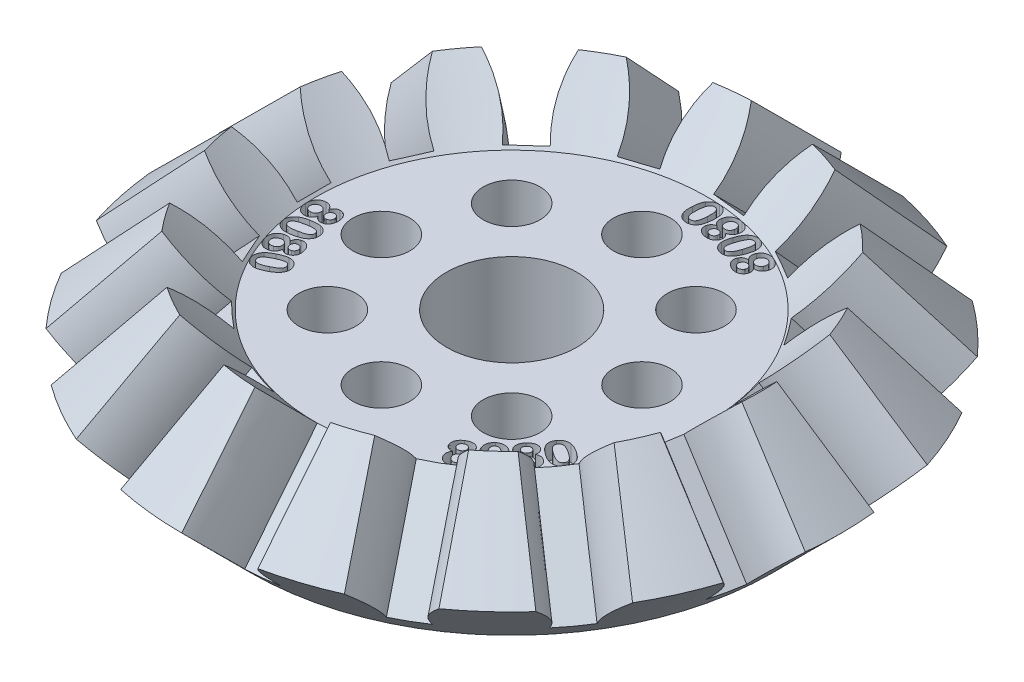
from build123d import *

# Parameters (mm, degrees)
CUT_EXTRUDE2_DEPTH = 10
CIRPATTERN2_COUNT  = 15
CUT_EXTRUDE3_DEPTH = 10
SKETCH5_3_R        = 1.75
CUT_EXTRUDE4_DEPTH = 10
CIRPATTERN3_COUNT  = 8
CUT_EXTRUDE5_DEPTH = 1
CIRPATTERN4_COUNT  = 3
CUT_EXTRUDE6_DEPTH = 1
CIRPATTERN5_COUNT  = 3


with BuildPart() as part:
    # Sketch2 → Revolve4 (revolve)
    with BuildSketch(Plane.XY):
        Polygon((0, 0), (0, 6), (-12, 6), (-15.242640687, 9.242640687), (-20.242640687, 4.242640687), (-16, 0), align=None)
    revolve(axis=Axis((0, 0, 0), (0, 1, 0)))

    # Sketch4 → Cut-Extrude2 (cut)
    with BuildSketch(Plane(origin=(-8, -8, 0), x_dir=(0, 0, 1), z_dir=(-0.7071067811865476, -0.7071067811865475, 0))):
        with BuildLine():
            Line((-1.03935201, 12.937434849), (1.03935201, 12.937434849))
            add(Edge.make_bspline(
                [(1.03935201, 12.937434849), (0.91336608, 15.612810457), (2.602452006, 17.968101502)],
                knots=[0, 0, 0, 1, 1, 1], degree=2))
            Line((2.602452006, 17.968101502), (-2.602452006, 17.968101502))
            add(Edge.make_bspline(
                [(-1.03935201, 12.937434849), (-0.91336608, 15.612810457), (-2.602452006, 17.968101502)],
                knots=[0, 0, 0, 1, 1, 1], degree=2))
        make_face()
    cut_extrude2 = extrude(amount=-CUT_EXTRUDE2_DEPTH, mode=Mode.SUBTRACT)

    # CirPattern2: Cut-Extrude2 ×15 about axis
    cirpattern2_axis = Axis((0, 0, 0), (0, 1, 0))
    for i in range(1, CIRPATTERN2_COUNT):
        add(cut_extrude2.rotate(cirpattern2_axis, i * 360 / CIRPATTERN2_COUNT), mode=Mode.SUBTRACT)

    # Sketch5 → Cut-Extrude3 (cut)
    with BuildSketch(Plane(origin=(0, 6, 0), x_dir=(1, 0, 0), z_dir=(0, 1, 0))):
        with BuildLine():
            ThreePointArc((4, 0), (-2.828427125, 2.828427125), (0, -4))
            ThreePointArc((0, -4), (2.828427125, -2.828427125), (4, 0))
        make_face()
    extrude(amount=-CUT_EXTRUDE3_DEPTH, mode=Mode.SUBTRACT)

    # Sketch5<3> → Cut-Extrude4 (cut)
    with BuildSketch(Plane(origin=(0, 6, 0), x_dir=(1, 0, 0), z_dir=(0, 1, 0))):
        with Locations((0, -8)):
            Circle(SKETCH5_3_R)
    cut_extrude4 = extrude(amount=-CUT_EXTRUDE4_DEPTH, mode=Mode.SUBTRACT)

    # CirPattern3: Cut-Extrude4 ×8 about axis
    cirpattern3_axis = Axis((0, 0, 0), (0, 1, 0))
    for i in range(1, CIRPATTERN3_COUNT):
        add(cut_extrude4.rotate(cirpattern3_axis, i * 360 / CIRPATTERN3_COUNT), mode=Mode.SUBTRACT)

    # Sketch6 → Cut-Extrude5 (cut)
    # profile 1 of 4: a face of its own
    with BuildSketch(Plane.XZ):
        with BuildLine():
            add(Edge.make_bspline(
                [(4.156488497, 13.050817381), (4.146886976, 13.017000759), (4.127777088, 12.949695607), (4.082307605, 12.854541888), (4.02293659, 12.766601195), (3.95262243, 12.684687567), (3.870368046, 12.611777395), (3.775729324, 12.551782441), (3.670761596, 12.503937627), (3.55597029, 12.46878012), (3.433046274, 12.447490077), (3.303683528, 12.443273299), (3.168707323, 12.453345724), (3.078549439, 12.472794856), (3.032216036, 12.482790037)],
                knots=[0, 0, 0, 0, 0.898095536, 1.787477642, 2.683578308, 3.605866973, 4.542565625, 5.484295766, 6.461536801, 7.48518869, 8.547527004, 9.642949623, 10.788678707, 12, 12, 12, 12], degree=3))
            add(Edge.make_bspline(
                [(3.032216036, 12.482790037), (2.993370716, 12.49290549), (2.91812223, 12.512500449), (2.81144956, 12.551500517), (2.713674609, 12.595758483), (2.625459313, 12.646817578), (2.546021975, 12.702733841), (2.476203307, 12.763567919), (2.41422589, 12.82763222), (2.362945153, 12.89686528), (2.320228155, 12.968695771), (2.285632166, 13.042346943), (2.260045907, 13.117844766), (2.243148861, 13.1950215), (2.235466558, 13.273249576), (2.234672451, 13.351930153), (2.241903366, 13.431185595), (2.253212703, 13.483339021), (2.258929903, 13.5097041)],
                knots=[0, 0, 0, 0, 1.333318355, 2.582812786, 3.769311356, 4.895725266, 5.964993095, 6.992490814, 7.969129994, 8.921229715, 9.848395047, 10.742710623, 11.620328461, 12.492092841, 13.362231804, 14.227803362, 15.104102869, 16, 16, 16, 16], degree=3))
            add(Edge.make_bspline(
                [(2.258929903, 13.5097041), (2.26813994, 13.542275489), (2.286193797, 13.606123139), (2.328690579, 13.695290153), (2.382150611, 13.775876596), (2.447495054, 13.847546164), (2.524452067, 13.90913172), (2.612253901, 13.960694652), (2.710295175, 14.002950273), (2.780764592, 14.021206178), (2.817035372, 14.030602537)],
                knots=[0, 0, 0, 0, 1.004493773, 1.969046113, 2.921471674, 3.869429133, 4.839385169, 5.83920948, 6.887835864, 8, 8, 8, 8], degree=3))
            add(Edge.make_bspline(
                [(2.817035372, 14.030602537), (2.792041328, 14.048714238), (2.743214203, 14.084096358), (2.678160642, 14.144333053), (2.620542633, 14.206620264), (2.572317754, 14.273170477), (2.532754784, 14.342576895), (2.500773524, 14.414672335), (2.47636113, 14.488959175), (2.460865808, 14.56619074), (2.45348591, 14.645592625), (2.454317107, 14.727408028), (2.462769848, 14.81135744), (2.474806817, 14.867233401), (2.480931856, 14.895666014)],
                knots=[0, 0, 0, 0, 1.117958334, 2.183987938, 3.207675155, 4.189367008, 5.155929513, 6.098554317, 7.044004074, 7.984482209, 8.947786368, 9.92939243, 10.94636651, 12, 12, 12, 12], degree=3))
            add(Edge.make_bspline(
                [(2.480931856, 14.895666014), (2.492412344, 14.936782371), (2.515051634, 15.017863), (2.568197582, 15.131366013), (2.634416081, 15.235467539), (2.700891553, 15.313579578), (2.759797097, 15.37070555), (2.808177882, 15.409084235), (2.858720664, 15.444794597), (2.91312752, 15.475445366), (2.96949592, 15.503509937), (3.028780848, 15.528152054), (3.091495145, 15.547394531), (3.156599882, 15.564309878), (3.224043085, 15.577591307), (3.293752425, 15.585193777), (3.365142554, 15.589712484), (3.438278458, 15.589863794), (3.512961482, 15.584406881), (3.589357994, 15.575892502), (3.667621958, 15.562901931), (3.719981374, 15.550985021), (3.746591036, 15.544928709)],
                knots=[0, 0, 0, 0, 1.598836312, 3.152873038, 4.679832113, 6.214506474, 6.987647475, 7.754073532, 8.528302152, 9.306248206, 10.093296498, 10.889456207, 11.71084635, 12.551368485, 13.411959711, 14.286098386, 15.179315877, 16.094141498, 17.026537748, 17.986284285, 18.97660638, 20, 20, 20, 20], degree=3))
            add(Edge.make_bspline(
                [(3.746591036, 15.544928709), (3.773951607, 15.537966792), (3.827798303, 15.524265462), (3.906028182, 15.499349429), (3.980232284, 15.471411158), (4.05098122, 15.441309422), (4.116865281, 15.406672429), (4.180177957, 15.371336037), (4.238245517, 15.331105299), (4.293034597, 15.289268012), (4.343173562, 15.24427653), (4.389678872, 15.198202828), (4.43164523, 15.149834539), (4.469530916, 15.099940724), (4.502501755, 15.047531326), (4.530946001, 14.993273487), (4.556178465, 14.937614694), (4.582062464, 14.860525209), (4.60614526, 14.761700863), (4.615945974, 14.639531503), (4.611203417, 14.514877248), (4.594238017, 14.432690138), (4.585609591, 14.390890623)],
                knots=[0, 0, 0, 0, 1.053870095, 2.074058362, 3.063094124, 4.013594071, 4.942033531, 5.840846242, 6.718437229, 7.576677808, 8.413023486, 9.231555307, 10.019238326, 10.801763118, 11.568255515, 12.327722884, 13.087778152, 13.846774874, 15.361115278, 16.871675534, 18.408966527, 20, 20, 20, 20], degree=3))
            add(Edge.make_bspline(
                [(4.585609591, 14.390890623), (4.579974734, 14.368665306), (4.568954699, 14.325199467), (4.546607423, 14.262893627), (4.522214472, 14.20377166), (4.493496714, 14.148562744), (4.461839172, 14.096933269), (4.42712678, 14.04874081), (4.38824507, 14.004816942), (4.347014285, 13.963456455), (4.301099397, 13.926831697), (4.252308688, 13.893624275), (4.200504077, 13.86305533), (4.144523455, 13.838461975), (4.085994738, 13.815502906), (4.023628288, 13.797356243), (3.958156677, 13.781345571), (3.912852587, 13.77474609), (3.889838106, 13.771393553)],
                knots=[0, 0, 0, 0, 1.10051538, 2.152267388, 3.175524199, 4.170063928, 5.137123619, 6.082280888, 7.018007306, 7.951625042, 8.883393767, 9.833335094, 10.785141898, 11.766916525, 12.766151819, 13.802566184, 14.883703426, 16, 16, 16, 16], degree=3))
            add(Edge.make_bspline(
                [(3.889838106, 13.771393553), (3.918854406, 13.746695232), (3.975016744, 13.698890535), (4.045264414, 13.617524907), (4.101689427, 13.53295092), (4.14332743, 13.444000416), (4.169634541, 13.350569593), (4.180680463, 13.253280779), (4.177052353, 13.152265287), (4.163458076, 13.085200487), (4.156488497, 13.050817381)],
                knots=[0, 0, 0, 0, 1.119144554, 2.166154006, 3.1490369, 4.100866883, 5.041863072, 5.990368265, 6.969692263, 8, 8, 8, 8], degree=3))
        make_face()
        with BuildLine():
            add(Edge.make_bspline(
                [(3.032216036, 14.743117186), (3.026750685, 14.718003264), (3.016081549, 14.668977349), (3.012356135, 14.595301637), (3.016181627, 14.524634369), (3.02990243, 14.457401565), (3.052347552, 14.394415398), (3.082865095, 14.335858212), (3.12256288, 14.283065883), (3.16912989, 14.234942764), (3.223094833, 14.193458484), (3.283352195, 14.159597229), (3.348185903, 14.13089893), (3.394369392, 14.118276802), (3.417928926, 14.111837889)],
                knots=[0, 0, 0, 0, 1.109137848, 2.165193404, 3.176661223, 4.161339434, 5.119270377, 6.058394671, 7.003618338, 7.963920967, 8.94494484, 9.933385007, 10.945759884, 12, 12, 12, 12], degree=3))
            add(Edge.make_bspline(
                [(3.417928926, 14.111837889), (3.434829716, 14.108252298), (3.468015976, 14.101211659), (3.518025728, 14.095549701), (3.567068031, 14.094813439), (3.615002303, 14.099372142), (3.661854968, 14.10779558), (3.707378185, 14.121898351), (3.752224558, 14.139668696), (3.795370676, 14.162671162), (3.836663128, 14.189846214), (3.87425756, 14.222213585), (3.908901418, 14.258651414), (3.939970026, 14.299460061), (3.966482702, 14.345386656), (3.990215945, 14.395043811), (4.010018924, 14.449328159), (4.020343311, 14.487338386), (4.02564377, 14.506852537)],
                knots=[0, 0, 0, 0, 1.015985201, 1.994980669, 2.955755357, 3.895992982, 4.823801745, 5.75097273, 6.694899268, 7.657749647, 8.622364684, 9.597121401, 10.569143446, 11.576063697, 12.606358235, 13.683389878, 14.810670591, 16, 16, 16, 16], degree=3))
            add(Edge.make_bspline(
                [(4.02564377, 14.506852537), (4.031116021, 14.531967493), (4.041842628, 14.581197371), (4.045442559, 14.65527944), (4.041849094, 14.72685074), (4.027102523, 14.79514455), (4.004866989, 14.859403907), (3.975731763, 14.919591381), (3.937435516, 14.973444881), (3.892419613, 15.022192042), (3.841393694, 15.064988191), (3.784034919, 15.099689912), (3.722234834, 15.128462206), (3.677979101, 15.140619936), (3.655433809, 15.146813475)],
                knots=[0, 0, 0, 0, 1.116063364, 2.187687044, 3.214443174, 4.224695234, 5.214052605, 6.166876134, 7.122071559, 8.07633587, 9.046640773, 10.007193619, 10.984800389, 12, 12, 12, 12], degree=3))
            add(Edge.make_bspline(
                [(3.655433809, 15.146813475), (3.632162154, 15.151536774), (3.586550217, 15.160794336), (3.517490583, 15.164450744), (3.450054786, 15.159018704), (3.384881979, 15.143836616), (3.322632099, 15.121024602), (3.264181149, 15.089768319), (3.210629218, 15.049495028), (3.161680106, 15.001907737), (3.118657502, 14.946754746), (3.081967552, 14.885217808), (3.052402714, 14.816803101), (3.039064874, 14.768116985), (3.032216036, 14.743117186)],
                knots=[0, 0, 0, 0, 1.026294652, 2.011515178, 2.980734755, 3.943994432, 4.8975737, 5.841881604, 6.800605331, 7.78720498, 8.787291365, 9.817979806, 10.879555982, 12, 12, 12, 12], degree=3))
        make_face(mode=Mode.SUBTRACT)
        with BuildLine():
            add(Edge.make_bspline(
                [(3.115931856, 12.882765623), (3.146392583, 12.876832657), (3.205134073, 12.865391326), (3.293254184, 12.867892922), (3.37584208, 12.887928432), (3.451238473, 12.925780875), (3.517748238, 12.97786414), (3.572816444, 13.043250423), (3.615213562, 13.120928386), (3.63192228, 13.178563316), (3.640550997, 13.208327147)],
                knots=[0, 0, 0, 0, 1.071484269, 2.066286315, 3.024052696, 3.990251383, 4.963416796, 5.927945532, 6.929949603, 8, 8, 8, 8], degree=3))
            add(Edge.make_bspline(
                [(3.640550997, 13.208327147), (3.646177758, 13.236737943), (3.657092609, 13.2918495), (3.651758526, 13.375386948), (3.631438034, 13.454949073), (3.593395243, 13.528753592), (3.542651474, 13.59530342), (3.477362062, 13.649584981), (3.4006921, 13.692255629), (3.343337118, 13.708462536), (3.313749239, 13.716823241)],
                knots=[0, 0, 0, 0, 1.023911318, 1.986193787, 2.941602221, 3.919167675, 4.912485257, 5.891123402, 6.912087753, 8, 8, 8, 8], degree=3))
            add(Edge.make_bspline(
                [(3.313749239, 13.716823241), (3.283082293, 13.722824494), (3.223716607, 13.734441841), (3.134999371, 13.730940036), (3.053271858, 13.711457703), (2.978909971, 13.678137608), (2.914604886, 13.629106239), (2.860899753, 13.567592336), (2.818033007, 13.493836228), (2.801827922, 13.438435518), (2.793470919, 13.409865233)],
                knots=[0, 0, 0, 0, 1.104658495, 2.13841991, 3.117642005, 4.068464312, 5.004864085, 5.960192684, 6.948066259, 8, 8, 8, 8], degree=3))
            add(Edge.make_bspline(
                [(2.793470919, 13.409865233), (2.789163746, 13.390105198), (2.78070551, 13.351301307), (2.778227806, 13.292411489), (2.781633909, 13.234937406), (2.79264455, 13.17912026), (2.811572005, 13.126358863), (2.836187753, 13.076772175), (2.868659042, 13.031620755), (2.906934657, 12.990099624), (2.951392844, 12.953411703), (3.001884616, 12.92372639), (3.056656757, 12.898942621), (3.095905247, 12.888231163), (3.115931856, 12.882765623)],
                knots=[0, 0, 0, 0, 1.04939043, 2.060746953, 3.051287766, 4.037390337, 5.005834523, 5.957202741, 6.90516756, 7.885929497, 8.886038174, 9.888395002, 10.922549972, 12, 12, 12, 12], degree=3))
        make_face(mode=Mode.SUBTRACT)
    # profile 2 of 4: a face of its own
    with BuildSketch(Plane.XZ):
        with BuildLine():
            add(Edge.make_bspline(
                [(0.066502963, 14.472114521), (0.071309287, 14.526721395), (0.080555604, 14.631773092), (0.099718147, 14.783023846), (0.12304271, 14.921901024), (0.150733098, 15.049832836), (0.184847456, 15.168617204), (0.227266891, 15.279913273), (0.276909469, 15.385363841), (0.317428818, 15.450600208), (0.337494174, 15.482905537)],
                knots=[0, 0, 0, 0, 1.243644045, 2.392499495, 3.458021874, 4.437739502, 5.360878318, 6.258884694, 7.137792243, 8, 8, 8, 8], degree=3))
            add(Edge.make_bspline(
                [(0.337494174, 15.482905537), (0.365278679, 15.521294086), (0.419745051, 15.596547722), (0.516485983, 15.694779679), (0.622728986, 15.776995501), (0.718175697, 15.833681964), (0.798565964, 15.869682255), (0.859803179, 15.893674614), (0.922750581, 15.912093555), (0.98675018, 15.926444702), (1.052024256, 15.936367591), (1.118519679, 15.941877141), (1.186272114, 15.943309142), (1.231711605, 15.940652663), (1.254647494, 15.939311787)],
                knots=[0, 0, 0, 0, 1.584207323, 3.105544812, 4.594436132, 6.070350288, 6.807171672, 7.540738529, 8.269593337, 8.999661783, 9.73440193, 10.4772066, 11.231359776, 12, 12, 12, 12], degree=3))
            add(Edge.make_bspline(
                [(1.254647494, 15.939311787), (1.280941886, 15.936552368), (1.332965062, 15.931092887), (1.409632309, 15.917006895), (1.483414867, 15.896084853), (1.555284932, 15.871053205), (1.623970844, 15.838911059), (1.690662369, 15.802631961), (1.754185031, 15.759804383), (1.815412441, 15.712499906), (1.872822727, 15.6597863), (1.926465539, 15.602989256), (1.976130337, 15.542495173), (2.020821689, 15.47728867), (2.062137645, 15.408659434), (2.097589188, 15.335013915), (2.130349927, 15.258236784), (2.147994815, 15.204820832), (2.156918002, 15.177807881)],
                knots=[0, 0, 0, 0, 1.009036943, 1.996368948, 2.970752607, 3.934083813, 4.897931897, 5.862038316, 6.829303739, 7.818903159, 8.813021893, 9.800952749, 10.799133847, 11.797190196, 12.816142921, 13.853593571, 14.914542023, 16, 16, 16, 16], degree=3))
            add(Edge.make_bspline(
                [(2.156918002, 15.177807881), (2.164748475, 15.147716866), (2.180627326, 15.086697467), (2.197569792, 14.991725466), (2.21052792, 14.89280943), (2.219189765, 14.789549016), (2.223286405, 14.682373237), (2.223807718, 14.571318158), (2.220988609, 14.456297305), (2.21551721, 14.378460943), (2.212728549, 14.338789326)],
                knots=[0, 0, 0, 0, 0.882937269, 1.790444837, 2.73796659, 3.716121195, 4.732748308, 5.783790544, 6.870442956, 8, 8, 8, 8], degree=3))
            add(Edge.make_bspline(
                [(2.212728549, 14.338789326), (2.208228007, 14.288121971), (2.199435436, 14.1891347), (2.182345563, 14.044924131), (2.161004276, 13.90870277), (2.137348273, 13.78073279), (2.109606507, 13.66147394), (2.077837051, 13.551416349), (2.04336822, 13.449876737), (2.014977764, 13.386922855), (2.001268588, 13.356523701)],
                knots=[0, 0, 0, 0, 1.208967006, 2.361922114, 3.450749277, 4.485623917, 5.454473637, 6.359445258, 7.207809364, 8, 8, 8, 8], degree=3))
            add(Edge.make_bspline(
                [(2.001268588, 13.356523701), (1.988859325, 13.332314353), (1.964488955, 13.284769966), (1.921545953, 13.218501142), (1.876978167, 13.156148215), (1.829530583, 13.098138681), (1.777502665, 13.046038498), (1.723085894, 12.998295247), (1.665724829, 12.954946281), (1.604891494, 12.917426916), (1.541638526, 12.884269434), (1.475359457, 12.85690737), (1.406663529, 12.834809843), (1.335667811, 12.817099802), (1.26219115, 12.805620459), (1.186387312, 12.7986309), (1.108033818, 12.797464338), (1.055164709, 12.800564107), (1.028304721, 12.802138935)],
                knots=[0, 0, 0, 0, 1.090573515, 2.141761449, 3.163465211, 4.164573063, 5.14370486, 6.113240552, 7.066760395, 8.023878439, 8.976965585, 9.928572865, 10.896121074, 11.869442993, 12.860439257, 13.876102873, 14.920960564, 16, 16, 16, 16], degree=3))
            add(Edge.make_bspline(
                [(1.028304721, 12.802138935), (0.993280408, 12.80586243), (0.924414102, 12.813183724), (0.824577845, 12.834504271), (0.730123296, 12.863470883), (0.641700049, 12.901578542), (0.559023325, 12.947515373), (0.482293514, 13.001080094), (0.411675523, 13.062426322), (0.34683641, 13.131464061), (0.288816505, 13.208869015), (0.235674258, 13.293134379), (0.188399902, 13.385095677), (0.162300472, 13.450343367), (0.148978549, 13.483647725)],
                knots=[0, 0, 0, 0, 1.07192158, 2.107658154, 3.103077062, 4.075850409, 5.03384971, 5.978522573, 6.920002687, 7.877422837, 8.856832473, 9.860969388, 10.908175294, 12, 12, 12, 12], degree=3))
            add(Edge.make_bspline(
                [(0.148978549, 13.483647725), (0.138280141, 13.514694998), (0.116155835, 13.578900756), (0.093189699, 13.681730048), (0.073376811, 13.792530411), (0.061018491, 13.912121689), (0.053652245, 14.040198218), (0.051807549, 14.176555114), (0.056518724, 14.321542187), (0.063104912, 14.42086851), (0.066502963, 14.472114521)],
                knots=[0, 0, 0, 0, 0.788315422, 1.630236204, 2.527439491, 3.491480676, 4.516153806, 5.608714507, 6.766250073, 8, 8, 8, 8], degree=3))
        make_face()
        with BuildLine():
            add(Edge.make_bspline(
                [(0.619027377, 14.387158467), (0.616555276, 14.356371362), (0.611714228, 14.296081812), (0.607973254, 14.207751907), (0.604204409, 14.123640636), (0.604076323, 14.043611846), (0.604345223, 13.967732931), (0.606860128, 13.895976049), (0.611123472, 13.828552167), (0.619006814, 13.746178591), (0.634141891, 13.652045488), (0.662408865, 13.550184043), (0.699314651, 13.46177916), (0.73922205, 13.398531524), (0.776661812, 13.356079919), (0.806826409, 13.327887713), (0.840985988, 13.304357156), (0.877585502, 13.283669235), (0.917396896, 13.267025486), (0.960228462, 13.254053287), (1.005783028, 13.243799028), (1.037554571, 13.240832048), (1.053729525, 13.239321553)],
                knots=[0, 0, 0, 0, 1.346792145, 2.637386518, 3.85515704, 5.018042075, 6.126842763, 7.164118969, 8.148706303, 9.072577397, 10.77237252, 12.299099744, 13.672123386, 14.937346554, 15.537731496, 16.137439338, 16.732658998, 17.342044507, 17.968200702, 18.609740713, 19.292216289, 20, 20, 20, 20], degree=3))
            add(Edge.make_bspline(
                [(1.053729525, 13.239321553), (1.076897472, 13.238195896), (1.121742476, 13.236017021), (1.186935484, 13.244523877), (1.247409219, 13.260977184), (1.302928734, 13.287623437), (1.353511287, 13.323376868), (1.399192157, 13.368052727), (1.439813073, 13.421688579), (1.475656676, 13.48443196), (1.507789487, 13.556434158), (1.536721316, 13.637784488), (1.562283295, 13.728915621), (1.58679987, 13.828854792), (1.606603401, 13.938963686), (1.625421469, 14.058185005), (1.640833181, 14.187266873), (1.648290222, 14.27654449), (1.652142611, 14.322666279)],
                knots=[0, 0, 0, 0, 0.80398259, 1.556227781, 2.271978484, 2.971826887, 3.682702954, 4.41358748, 5.181589094, 6.011301575, 6.917146062, 7.916051091, 9.006429621, 10.202366417, 11.487579126, 12.889427262, 14.39304428, 16, 16, 16, 16], degree=3))
            add(Edge.make_bspline(
                [(1.652142611, 14.322666279), (1.654511726, 14.354285114), (1.659154548, 14.416249457), (1.664338253, 14.506997662), (1.666459225, 14.593647701), (1.667995824, 14.675714302), (1.667358347, 14.753667569), (1.664959132, 14.8272833), (1.660669318, 14.896773633), (1.652738361, 14.981376541), (1.638146762, 15.078124483), (1.610885183, 15.18337244), (1.573165292, 15.274054179), (1.533595089, 15.339442339), (1.496843469, 15.383335358), (1.466493481, 15.411362217), (1.43412545, 15.436750384), (1.398186149, 15.45763369), (1.359386681, 15.474439272), (1.317960559, 15.487303844), (1.273891073, 15.497727349), (1.243129482, 15.500637529), (1.227362338, 15.50212917)],
                knots=[0, 0, 0, 0, 1.360894033, 2.666983303, 3.900678559, 5.080765719, 6.1897803, 7.246124656, 8.241708746, 9.177466331, 10.89276126, 12.435771674, 13.831387388, 15.094369982, 15.698697453, 16.282420901, 16.864456405, 17.460918107, 18.060866573, 18.675333066, 19.321029417, 20, 20, 20, 20], degree=3))
            add(Edge.make_bspline(
                [(1.227362338, 15.50212917), (1.211040634, 15.503042456), (1.179212797, 15.504823393), (1.132384053, 15.502529616), (1.088248722, 15.494749511), (1.04631251, 15.483883121), (1.006908698, 15.467994671), (0.969391543, 15.448543103), (0.935322371, 15.422982775), (0.891346763, 15.384379781), (0.841581512, 15.324708084), (0.792098966, 15.2389258), (0.747470681, 15.139680805), (0.719114215, 15.046293611), (0.698974871, 14.964073999), (0.684132834, 14.89627805), (0.670527847, 14.823482056), (0.658064162, 14.745740687), (0.647281809, 14.662964416), (0.636456758, 14.57536831), (0.62739056, 14.482911222), (0.621862285, 14.419616238), (0.619027377, 14.387158467)],
                knots=[0, 0, 0, 0, 0.691528299, 1.348502021, 1.978362456, 2.585207598, 3.178085747, 3.772896569, 4.367771705, 4.975057983, 6.247379851, 7.632012237, 9.155183966, 10.842739732, 11.752870843, 12.737700376, 13.779060257, 14.886369609, 16.069024533, 17.311314272, 18.621237543, 20, 20, 20, 20], degree=3))
        make_face(mode=Mode.SUBTRACT)
    # profile 3 of 4: a face of its own
    with BuildSketch(Plane.XZ):
        with BuildLine():
            add(Edge.make_bspline(
                [(-0.116582031, 13.674560547), (-0.115091128, 13.640417331), (-0.112114148, 13.572241425), (-0.126987736, 13.470589859), (-0.154306457, 13.370552545), (-0.196546712, 13.273725743), (-0.252438269, 13.181240729), (-0.323125324, 13.09643293), (-0.408048795, 13.02037788), (-0.505533109, 12.952746724), (-0.615240842, 12.895778606), (-0.736135966, 12.851787333), (-0.867242918, 12.820326843), (-0.958744503, 12.810719953), (-1.005830078, 12.805776367)],
                knots=[0, 0, 0, 0, 0.884576159, 1.766288867, 2.650670085, 3.567846758, 4.4964046, 5.444274213, 6.41969592, 7.444272018, 8.513629038, 9.616026556, 10.773236994, 12, 12, 12, 12], degree=3))
            add(Edge.make_bspline(
                [(-1.005830078, 12.805776367), (-1.045500901, 12.803579059), (-1.122757935, 12.799299907), (-1.235628291, 12.802078394), (-1.341868982, 12.814525755), (-1.441162256, 12.835339074), (-1.53341289, 12.864737168), (-1.618497234, 12.900684861), (-1.696955278, 12.942668285), (-1.766969119, 12.992703503), (-1.829769255, 13.04775763), (-1.884476066, 13.107726729), (-1.932417598, 13.171379273), (-1.971686943, 13.23973537), (-2.004533724, 13.311199606), (-2.028074077, 13.386400082), (-2.047062879, 13.463754152), (-2.052388399, 13.516947397), (-2.055068359, 13.54371582)],
                knots=[0, 0, 0, 0, 1.323121768, 2.576716438, 3.755287386, 4.881531449, 5.950703369, 6.975038489, 7.954807527, 8.908090091, 9.834973235, 10.731647788, 11.60746037, 12.483705879, 13.352698677, 14.221473231, 15.1049924, 16, 16, 16, 16], degree=3))
            add(Edge.make_bspline(
                [(-2.055068359, 13.54371582), (-2.056444659, 13.57763959), (-2.059139698, 13.644068351), (-2.046732145, 13.741997815), (-2.02203068, 13.835489109), (-1.983155559, 13.924036061), (-1.931228972, 14.00723783), (-1.865973819, 14.083927524), (-1.787851316, 14.154248705), (-1.728017424, 14.193345357), (-1.697260742, 14.213442383)],
                knots=[0, 0, 0, 0, 1.014298806, 1.986177083, 2.94026276, 3.898488352, 4.868022353, 5.86415371, 6.902101454, 8, 8, 8, 8], degree=3))
            add(Edge.make_bspline(
                [(-1.697260742, 14.213442383), (-1.725756266, 14.223096128), (-1.781595382, 14.242013366), (-1.860607922, 14.277828011), (-1.932371374, 14.320546331), (-1.997850969, 14.367995575), (-2.056005717, 14.422004681), (-2.107190225, 14.48086939), (-2.152702212, 14.544048979), (-2.19045116, 14.612655151), (-2.221474702, 14.686059088), (-2.245586885, 14.763969399), (-2.263260649, 14.84615906), (-2.269123562, 14.902728762), (-2.272109375, 14.931538086)],
                knots=[0, 0, 0, 0, 1.101130901, 2.157748555, 3.168828431, 4.154233089, 5.112857275, 6.067560079, 7.00626106, 7.958170178, 8.928050146, 9.919018832, 10.940216098, 12, 12, 12, 12], degree=3))
            add(Edge.make_bspline(
                [(-2.272109375, 14.931538086), (-2.27383165, 14.97413499), (-2.277219325, 15.057922139), (-2.263237863, 15.18221127), (-2.232521438, 15.301181778), (-2.19432276, 15.395940689), (-2.155501735, 15.467905397), (-2.122121657, 15.519581357), (-2.085305569, 15.569112429), (-2.04446147, 15.615812635), (-1.99861397, 15.658806291), (-1.950543652, 15.700995485), (-1.897405554, 15.739093098), (-1.841091793, 15.77527469), (-1.780858687, 15.807922683), (-1.717781463, 15.837704043), (-1.65172859, 15.863854957), (-1.58275285, 15.886208269), (-1.510596132, 15.904600242), (-1.43553513, 15.920225128), (-1.357485241, 15.932056755), (-1.304343968, 15.936818102), (-1.277441406, 15.939228516)],
                knots=[0, 0, 0, 0, 1.604127074, 3.155281752, 4.690604901, 6.220350288, 6.990279001, 7.76780807, 8.535528872, 9.313408733, 10.100893369, 10.901510016, 11.720690681, 12.560914999, 13.421562991, 14.299299379, 15.187062656, 16.095649028, 17.028564348, 17.990593271, 18.982745689, 20, 20, 20, 20], degree=3))
            add(Edge.make_bspline(
                [(-1.277441406, 15.939228516), (-1.249342496, 15.941203559), (-1.194223642, 15.945077806), (-1.112667738, 15.94532003), (-1.033991913, 15.942617616), (-0.958240384, 15.935017719), (-0.885371712, 15.923866201), (-0.815088518, 15.909113424), (-0.747462737, 15.890042627), (-0.683060884, 15.866198353), (-0.621662522, 15.839727612), (-0.56351413, 15.809894257), (-0.509273406, 15.776337049), (-0.458023668, 15.740457174), (-0.410751272, 15.701040217), (-0.366594634, 15.658982431), (-0.326149072, 15.613560928), (-0.277530049, 15.548988021), (-0.225284071, 15.462289219), (-0.176046727, 15.350463982), (-0.143656346, 15.230110706), (-0.133932132, 15.146892744), (-0.128984375, 15.104550781)],
                knots=[0, 0, 0, 0, 1.056449444, 2.072332418, 3.057930323, 4.008557719, 4.926520967, 5.822337394, 6.7011091, 7.559736944, 8.39673162, 9.208302166, 10.008944104, 10.78780925, 11.553318873, 12.315679857, 13.073650441, 13.832057244, 15.345497282, 16.859632493, 18.402155969, 20, 20, 20, 20], degree=3))
            add(Edge.make_bspline(
                [(-0.128984375, 15.104550781), (-0.12771849, 15.081823245), (-0.125233958, 15.037216245), (-0.125530622, 14.971096498), (-0.131399049, 14.907532267), (-0.140545561, 14.846154633), (-0.154078821, 14.787208809), (-0.172356336, 14.730780343), (-0.193513228, 14.676377607), (-0.221160828, 14.625396753), (-0.250871415, 14.57567166), (-0.286081053, 14.529002824), (-0.325223888, 14.484778504), (-0.369044198, 14.443205121), (-0.416473605, 14.403539549), (-0.468694335, 14.366734688), (-0.524792278, 14.332074298), (-0.564581565, 14.311379416), (-0.584770508, 14.300878906)],
                knots=[0, 0, 0, 0, 1.103797695, 2.166407453, 3.202831455, 4.196641259, 5.174139608, 6.131540093, 7.071570366, 7.999713639, 8.940117968, 9.878382824, 10.82988767, 11.801198607, 12.804868276, 13.825661991, 14.896748649, 16, 16, 16, 16], degree=3))
            add(Edge.make_bspline(
                [(-0.584770508, 14.300878906), (-0.550437925, 14.285602995), (-0.48364066, 14.255882273), (-0.393301292, 14.198449927), (-0.315192029, 14.132606558), (-0.248955556, 14.058344541), (-0.19663095, 13.974170761), (-0.156986976, 13.881899119), (-0.127989688, 13.781514364), (-0.120460932, 13.710927636), (-0.116582031, 13.674560547)],
                knots=[0, 0, 0, 0, 1.087580958, 2.115990961, 3.089066282, 4.039486943, 4.986618877, 5.946782114, 6.942158682, 8, 8, 8, 8], degree=3))
        make_face()
        with BuildLine():
            add(Edge.make_bspline(
                [(-1.715244141, 14.958203125), (-1.712408462, 14.932246297), (-1.706901244, 14.881835116), (-1.68753354, 14.80974407), (-1.661952197, 14.742941626), (-1.627648772, 14.682332073), (-1.585871112, 14.629053092), (-1.538310471, 14.582176711), (-1.483715843, 14.543605057), (-1.423369813, 14.5126096), (-1.358264087, 14.489599343), (-1.289580896, 14.475879462), (-1.218251528, 14.468220991), (-1.16996548, 14.470744924), (-1.145356445, 14.47203125)],
                knots=[0, 0, 0, 0, 1.113271865, 2.162103517, 3.176510603, 4.160560202, 5.12264012, 6.058749116, 7.001531514, 7.964582332, 8.947047818, 9.938783727, 10.949498971, 12, 12, 12, 12], degree=3))
            add(Edge.make_bspline(
                [(-1.145356445, 14.47203125), (-1.1279216, 14.473669861), (-1.093586361, 14.476896853), (-1.043922698, 14.489070105), (-0.995878564, 14.502354108), (-0.951205788, 14.52231875), (-0.908350318, 14.544949952), (-0.8691349, 14.573349802), (-0.831148151, 14.604344579), (-0.79671163, 14.640232839), (-0.766003131, 14.679845277), (-0.738517162, 14.722099269), (-0.718043788, 14.768435162), (-0.700679745, 14.817214089), (-0.689416695, 14.869549651), (-0.681608149, 14.924666205), (-0.680114247, 14.983045515), (-0.682261701, 15.022706207), (-0.683369141, 15.04315918)],
                knots=[0, 0, 0, 0, 1.015046838, 1.998978123, 2.963250969, 3.903865883, 4.832774637, 5.771550914, 6.708715426, 7.676118794, 8.650639879, 9.616031935, 10.593208798, 11.583630416, 12.617022324, 13.694611208, 14.811113728, 16, 16, 16, 16], degree=3))
            add(Edge.make_bspline(
                [(-0.683369141, 15.04315918), (-0.686238753, 15.069309224), (-0.691812649, 15.120102706), (-0.710756349, 15.193130276), (-0.738181496, 15.260323182), (-0.773010736, 15.321992263), (-0.814301104, 15.377249195), (-0.862266691, 15.42507661), (-0.915563138, 15.465595111), (-0.974495473, 15.497719491), (-1.036966899, 15.523049324), (-1.103339061, 15.537993207), (-1.172048809, 15.546134753), (-1.218514114, 15.544037808), (-1.242094727, 15.542973633)],
                knots=[0, 0, 0, 0, 1.127113611, 2.189289807, 3.223120197, 4.231436128, 5.21900122, 6.171815879, 7.127471878, 8.079791525, 9.042820258, 10.008294058, 10.989231926, 12, 12, 12, 12], degree=3))
            add(Edge.make_bspline(
                [(-1.242094727, 15.542973633), (-1.265968875, 15.540274242), (-1.312836714, 15.53497501), (-1.380511885, 15.516710614), (-1.443664007, 15.489826286), (-1.501846947, 15.454931179), (-1.555060173, 15.413694966), (-1.600504471, 15.364370464), (-1.640133373, 15.309424957), (-1.672164095, 15.248020789), (-1.696536161, 15.181337677), (-1.711819532, 15.11020479), (-1.718957717, 15.035208994), (-1.716500381, 14.984252918), (-1.715244141, 14.958203125)],
                knots=[0, 0, 0, 0, 1.024953363, 2.012107337, 2.98113589, 3.947023075, 4.902446006, 5.845513898, 6.800896046, 7.78805002, 8.793390196, 9.823651876, 10.887406137, 12, 12, 12, 12], degree=3))
        make_face(mode=Mode.SUBTRACT)
        with BuildLine():
            add(Edge.make_bspline(
                [(-1.049238281, 13.20203125), (-1.033266389, 13.203531087), (-1.001897686, 13.206476759), (-0.956616825, 13.216965818), (-0.913703328, 13.229617471), (-0.87341002, 13.246421406), (-0.836412179, 13.267887767), (-0.801069361, 13.291773956), (-0.769704409, 13.320831698), (-0.730735446, 13.362659689), (-0.690552694, 13.422515474), (-0.658832841, 13.503544083), (-0.641880039, 13.59223295), (-0.644292468, 13.653413773), (-0.645541992, 13.685102539)],
                knots=[0, 0, 0, 0, 0.815570086, 1.601774794, 2.360543177, 3.091299717, 3.816812343, 4.534734192, 5.257266032, 5.986885796, 7.442860379, 8.892397536, 10.390409194, 12, 12, 12, 12], degree=3))
            add(Edge.make_bspline(
                [(-0.645541992, 13.685102539), (-0.649284651, 13.714322575), (-0.656555409, 13.771087513), (-0.687677707, 13.850253758), (-0.73237668, 13.920982152), (-0.792191593, 13.980401081), (-0.862276586, 14.028808851), (-0.942119906, 14.061501458), (-1.029971476, 14.078107147), (-1.090523247, 14.075752213), (-1.121791992, 14.074536133)],
                knots=[0, 0, 0, 0, 1.024060313, 1.989413055, 2.939378651, 3.923290389, 4.909128444, 5.891850845, 6.911358344, 8, 8, 8, 8], degree=3))
            add(Edge.make_bspline(
                [(-1.121791992, 14.074536133), (-1.137756178, 14.073003491), (-1.169310957, 14.069974073), (-1.214953511, 14.059856487), (-1.258162756, 14.04621794), (-1.311212844, 14.023299312), (-1.371537111, 13.986694676), (-1.432359791, 13.930438504), (-1.480203301, 13.863267646), (-1.512166621, 13.786178965), (-1.529774058, 13.700757091), (-1.527765637, 13.641769174), (-1.526728516, 13.611308594)],
                knots=[0, 0, 0, 0, 0.696644278, 1.376985724, 2.027784286, 2.663772919, 3.885922847, 5.074984873, 6.24183614, 7.441849394, 8.679004855, 10, 10, 10, 10], degree=3))
            add(Edge.make_bspline(
                [(-1.526728516, 13.611308594), (-1.524653226, 13.590733001), (-1.520576393, 13.550312991), (-1.504100748, 13.492554351), (-1.483539213, 13.437688499), (-1.454710401, 13.387571048), (-1.420168718, 13.342216787), (-1.379720404, 13.302805669), (-1.335052584, 13.268353898), (-1.285000127, 13.240216002), (-1.230635737, 13.219382801), (-1.172697141, 13.205575216), (-1.111780391, 13.199225534), (-1.070327561, 13.201085159), (-1.049238281, 13.20203125)],
                knots=[0, 0, 0, 0, 1.054405286, 2.071341098, 3.05771759, 4.041377098, 5.012945711, 5.961281589, 6.918046245, 7.887316645, 8.883536054, 9.882438285, 10.922682692, 12, 12, 12, 12], degree=3))
        make_face(mode=Mode.SUBTRACT)
    # profile 4 of 4: a face of its own
    with BuildSketch(Plane.XZ):
        with BuildLine():
            add(Edge.make_bspline(
                [(-4.433368191, 13.780063741), (-4.44627974, 13.834734027), (-4.471177265, 13.94015553), (-4.49892769, 14.094107395), (-4.521657893, 14.23681253), (-4.53494859, 14.370343347), (-4.539897097, 14.496935492), (-4.534442109, 14.618932424), (-4.518572764, 14.737261415), (-4.500164409, 14.813722995), (-4.49103909, 14.851626241)],
                knots=[0, 0, 0, 0, 1.242639049, 2.396198819, 3.460200279, 4.439066665, 5.363456681, 6.260796031, 7.137848377, 8, 8, 8, 8], degree=3))
            add(Edge.make_bspline(
                [(-4.49103909, 14.851626241), (-4.476376729, 14.89462687), (-4.447528401, 14.979231001), (-4.386818779, 15.097266238), (-4.312133463, 15.203694477), (-4.225149833, 15.298918784), (-4.126367941, 15.381660484), (-4.017059327, 15.450203155), (-3.898011983, 15.504684744), (-3.81343551, 15.528072963), (-3.770462918, 15.539956319)],
                knots=[0, 0, 0, 0, 1.042556805, 2.05124008, 3.036530384, 4.021225595, 5.00547425, 5.986912972, 6.977167447, 8, 8, 8, 8], degree=3))
            add(Edge.make_bspline(
                [(-3.770462918, 15.539956319), (-3.74510626, 15.545487196), (-3.694891983, 15.556440097), (-3.619215598, 15.566348312), (-3.544154409, 15.570012281), (-3.469944059, 15.568189616), (-3.396099781, 15.560778185), (-3.323042053, 15.54722519), (-3.250820185, 15.527016208), (-3.179453478, 15.501705528), (-3.109979558, 15.470702479), (-3.042427642, 15.435550215), (-2.97848215, 15.394155918), (-2.916946014, 15.34817055), (-2.857915374, 15.297367899), (-2.80209756, 15.241108908), (-2.748425467, 15.180547623), (-2.715946181, 15.136720487), (-2.699520535, 15.114555929)],
                knots=[0, 0, 0, 0, 1.015290794, 2.010599872, 2.982492895, 3.953476614, 4.912902005, 5.88385203, 6.85722506, 7.844812564, 8.844352901, 9.832172268, 10.821712345, 11.821514497, 12.836644161, 13.866206233, 14.920883265, 16, 16, 16, 16], degree=3))
            add(Edge.make_bspline(
                [(-2.699520535, 15.114555929), (-2.682160575, 15.087927497), (-2.646808443, 15.033700884), (-2.600651797, 14.946341553), (-2.555198278, 14.854611963), (-2.51500263, 14.756408487), (-2.47646342, 14.653445667), (-2.440418951, 14.545549113), (-2.407665765, 14.432253411), (-2.387809766, 14.354760094), (-2.377679715, 14.315224874)],
                knots=[0, 0, 0, 0, 0.880541088, 1.793149551, 2.736040311, 3.717008427, 4.732175991, 5.78292963, 6.868904181, 8, 8, 8, 8], degree=3))
            add(Edge.make_bspline(
                [(-2.377679715, 14.315224874), (-2.365844607, 14.264225939), (-2.3428106, 14.16496957), (-2.313435661, 14.018844338), (-2.290298852, 13.87945351), (-2.273826531, 13.74682168), (-2.261746478, 13.621743154), (-2.258480252, 13.504141361), (-2.259923952, 13.394312451), (-2.267411297, 13.324037626), (-2.271019558, 13.290171163)],
                knots=[0, 0, 0, 0, 1.213069419, 2.360929048, 3.453075463, 4.486187545, 5.457531507, 6.363232382, 7.211217805, 8, 8, 8, 8], degree=3))
            add(Edge.make_bspline(
                [(-2.271019558, 13.290171163), (-2.275701511, 13.26448281), (-2.284932784, 13.213833823), (-2.303442287, 13.139727036), (-2.326854445, 13.069228836), (-2.35524834, 13.002263726), (-2.387005156, 12.938530425), (-2.424065909, 12.878593125), (-2.465121495, 12.822028358), (-2.510132593, 12.768568471), (-2.560117799, 12.71961392), (-2.613584273, 12.674232242), (-2.670738937, 12.63235588), (-2.732278175, 12.595259782), (-2.797706275, 12.562387976), (-2.866728933, 12.53333189), (-2.939459587, 12.507419708), (-2.990032946, 12.494378778), (-3.015780301, 12.487739522)],
                knots=[0, 0, 0, 0, 1.072580053, 2.114775208, 3.135258133, 4.121016376, 5.100867537, 6.05778109, 7.012431005, 7.970399091, 8.925200083, 9.883168169, 10.849680342, 11.832764617, 12.83160486, 13.85526302, 14.908095027, 16, 16, 16, 16], degree=3))
            add(Edge.make_bspline(
                [(-3.015780301, 12.487739522), (-3.049781504, 12.480500606), (-3.116332663, 12.466331748), (-3.216434142, 12.456000798), (-3.313839376, 12.454293472), (-3.408566698, 12.463222275), (-3.50039474, 12.48089257), (-3.588391077, 12.509383467), (-3.673918353, 12.545341048), (-3.755572336, 12.591523695), (-3.83436261, 12.646687068), (-3.909883371, 12.710625762), (-3.98245671, 12.78372758), (-4.026797169, 12.837724683), (-4.049515652, 12.86539089)],
                knots=[0, 0, 0, 0, 1.068367798, 2.091135224, 3.08918945, 4.059469743, 5.011887366, 5.958752478, 6.898571712, 7.860487363, 8.837407804, 9.852322925, 10.899606212, 12, 12, 12, 12], degree=3))
            add(Edge.make_bspline(
                [(-4.049515652, 12.86539089), (-4.069175171, 12.891757463), (-4.109697291, 12.946104136), (-4.164035323, 13.036470632), (-4.215911702, 13.136119327), (-4.264946631, 13.245956994), (-4.311085642, 13.365514932), (-4.355048506, 13.494832301), (-4.39683772, 13.63373146), (-4.420956473, 13.730345381), (-4.433368191, 13.780063741)],
                knots=[0, 0, 0, 0, 0.789795514, 1.627923304, 2.529797207, 3.487897404, 4.516238637, 5.607770182, 6.768937823, 8, 8, 8, 8], degree=3))
        make_face()
        with BuildLine():
            add(Edge.make_bspline(
                [(-3.867201199, 13.873081319), (-3.852136503, 13.81301984), (-3.823434364, 13.698587199), (-3.775640139, 13.537018982), (-3.727002685, 13.393706115), (-3.677412995, 13.268022272), (-3.623960361, 13.160163328), (-3.567283567, 13.068833207), (-3.506489561, 12.993607515), (-3.450518021, 12.943834598), (-3.403581257, 12.91314964), (-3.367058621, 12.895980664), (-3.329733398, 12.881735348), (-3.290215117, 12.87330171), (-3.249273708, 12.869013596), (-3.206834738, 12.868865132), (-3.163083964, 12.874220885), (-3.133769325, 12.8802692), (-3.118719754, 12.883374288)],
                knots=[0, 0, 0, 0, 2.150374837, 4.097019868, 5.849640228, 7.405357695, 8.78587193, 10.024724947, 11.131415863, 12.133610821, 12.611533139, 13.073889471, 13.532665061, 13.995967876, 14.472432205, 14.960596879, 15.46639047, 16, 16, 16, 16], degree=3))
            add(Edge.make_bspline(
                [(-3.118719754, 12.883374288), (-3.097646257, 12.889413609), (-3.05673315, 12.901138638), (-2.999975643, 12.927878574), (-2.951172215, 12.963112714), (-2.909140713, 13.005464453), (-2.875181046, 13.055764388), (-2.847520945, 13.112883757), (-2.827777698, 13.177524104), (-2.81611863, 13.249687634), (-2.8091593, 13.329501237), (-2.809314309, 13.417558512), (-2.813556889, 13.514003181), (-2.82381337, 13.618888403), (-2.839412948, 13.732438966), (-2.860867006, 13.854349894), (-2.886574631, 13.98499412), (-2.907965919, 14.074278113), (-2.919042019, 14.120508077)],
                knots=[0, 0, 0, 0, 0.75588728, 1.467516182, 2.152577307, 2.82356226, 3.516197433, 4.237347352, 5.006849305, 5.839632817, 6.756215456, 7.769340324, 8.876315777, 10.087438761, 11.405180144, 12.83145679, 14.359374015, 16, 16, 16, 16], degree=3))
            add(Edge.make_bspline(
                [(-2.919042019, 14.120508077), (-2.934528341, 14.18222093), (-2.964072737, 14.29995508), (-3.012917036, 14.466123425), (-3.06276465, 14.613402093), (-3.11411891, 14.742255872), (-3.167563284, 14.853571027), (-3.225128015, 14.947840076), (-3.287190742, 15.025101105), (-3.343577746, 15.077115342), (-3.390584166, 15.109302029), (-3.426566653, 15.128260164), (-3.463763813, 15.142684185), (-3.502593532, 15.151870709), (-3.542727892, 15.156915208), (-3.584082596, 15.157360394), (-3.626973744, 15.153858968), (-3.655384244, 15.147561931), (-3.670003933, 15.144321554)],
                knots=[0, 0, 0, 0, 2.171187605, 4.142134341, 5.908921969, 7.475601801, 8.873202576, 10.118200881, 11.236439041, 12.245261165, 12.7226579, 13.17703708, 13.630319783, 14.080297026, 14.535278141, 15.007961025, 15.489509114, 16, 16, 16, 16], degree=3))
            add(Edge.make_bspline(
                [(-3.670003933, 15.144321554), (-3.684960563, 15.140234661), (-3.71406349, 15.132282299), (-3.75559019, 15.116360895), (-3.79250729, 15.095459604), (-3.827004051, 15.072567385), (-3.857047002, 15.044870077), (-3.884884164, 15.014727133), (-3.907762166, 14.979861045), (-3.93471391, 14.928410792), (-3.960105195, 14.854837818), (-3.978869822, 14.756740609), (-3.986407269, 14.646472119), (-3.983319483, 14.546982697), (-3.975893079, 14.460646935), (-3.967791539, 14.389929136), (-3.957112494, 14.314686611), (-3.944182151, 14.235070575), (-3.928484812, 14.150959912), (-3.910443549, 14.062285211), (-3.890169804, 13.96900507), (-3.874965498, 13.905507349), (-3.867201199, 13.873081319)],
                knots=[0, 0, 0, 0, 0.652201317, 1.269067161, 1.864538036, 2.433778574, 3.006462666, 3.579146757, 4.155581879, 4.754598008, 6.019861092, 7.411495625, 8.946164112, 10.65983126, 11.59359082, 12.591361734, 13.653914025, 14.790467218, 15.984389577, 17.253233601, 18.597324012, 20, 20, 20, 20], degree=3))
        make_face(mode=Mode.SUBTRACT)
    cut_extrude5 = extrude(amount=-CUT_EXTRUDE5_DEPTH, mode=Mode.SUBTRACT)

    # CirPattern4: Cut-Extrude5 ×3 about axis
    cirpattern4_axis = Axis((0, 24.485281374, 0), (0, -1, 0))
    for i in range(1, CIRPATTERN4_COUNT):
        add(cut_extrude5.rotate(cirpattern4_axis, i * 360 / CIRPATTERN4_COUNT), mode=Mode.SUBTRACT)

    # Sketch7 → Cut-Extrude6 (cut)
    # profile 1 of 4: a face of its own
    with BuildSketch(Plane(origin=(0, 6, 0), x_dir=(1, 0, 0), z_dir=(0, 1, 0))):
        with BuildLine():
            add(Edge.make_bspline(
                [(0.055292362, 11.039811552), (0.057958414, 11.074202862), (0.063096147, 11.140478164), (0.073711909, 11.235943869), (0.088002597, 11.323441162), (0.103890704, 11.404161633), (0.124999422, 11.478912687), (0.150087739, 11.549411132), (0.18092906, 11.615893767), (0.205829008, 11.657205552), (0.218182987, 11.677702177)],
                knots=[0, 0, 0, 0, 1.24403377, 2.397370582, 3.462766453, 4.440837181, 5.362612323, 6.261311418, 7.137358785, 8, 8, 8, 8], degree=3))
            add(Edge.make_bspline(
                [(0.218182987, 11.677702177), (0.235428484, 11.702005732), (0.269268118, 11.749694901), (0.329437501, 11.81209352), (0.395007172, 11.865565914), (0.454890391, 11.901517911), (0.505180761, 11.924949114), (0.543561466, 11.940290797), (0.583095793, 11.952308385), (0.62306432, 11.962231596), (0.664100893, 11.968857146), (0.705865602, 11.972544228), (0.748527735, 11.974500435), (0.777169558, 11.972993656), (0.791620487, 11.972233427)],
                knots=[0, 0, 0, 0, 1.582984985, 3.106180934, 4.593200904, 6.071731909, 6.805912463, 7.542733435, 8.267712544, 9.001664467, 9.731390239, 10.475560986, 11.230860376, 12, 12, 12, 12], degree=3))
            add(Edge.make_bspline(
                [(0.791620487, 11.972233427), (0.808187609, 11.970793126), (0.841097721, 11.967932012), (0.889427031, 11.959246553), (0.936182876, 11.947110289), (0.981266823, 11.931461283), (1.024832182, 11.912135002), (1.067012736, 11.889621443), (1.107418805, 11.863213665), (1.146040327, 11.83353433), (1.182575074, 11.80086743), (1.216779488, 11.765486299), (1.24837278, 11.727626751), (1.277456104, 11.687220527), (1.303672859, 11.644108317), (1.327017678, 11.598352795), (1.347904878, 11.550068629), (1.359539394, 11.516584104), (1.365448612, 11.499577177)],
                knots=[0, 0, 0, 0, 1.007791007, 2.001947867, 2.972699073, 3.933870104, 4.89169634, 5.859425695, 6.82940626, 7.814653511, 8.809812798, 9.797965272, 10.795563755, 11.796747649, 12.813495881, 13.851474145, 14.908754911, 16, 16, 16, 16], degree=3))
            add(Edge.make_bspline(
                [(1.365448612, 11.499577177), (1.370446336, 11.480741165), (1.380624891, 11.442379029), (1.39274797, 11.382955345), (1.401562587, 11.320716602), (1.407802989, 11.25593527), (1.411183624, 11.188547962), (1.412281773, 11.11872067), (1.411294571, 11.046268666), (1.408353567, 10.997225372), (1.406854862, 10.972233427)],
                knots=[0, 0, 0, 0, 0.879790471, 1.791814646, 2.736326514, 3.716785717, 4.729380285, 5.781893201, 6.869676133, 8, 8, 8, 8], degree=3))
            add(Edge.make_bspline(
                [(1.406854862, 10.972233427), (1.404411454, 10.940318423), (1.399638726, 10.877978593), (1.389979712, 10.787155219), (1.37792816, 10.701281117), (1.36341746, 10.620671176), (1.347542829, 10.545268934), (1.327997724, 10.47579081), (1.307279248, 10.411644466), (1.289851197, 10.371851756), (1.281464237, 10.352702177)],
                knots=[0, 0, 0, 0, 1.209251171, 2.362039913, 3.450118562, 4.484564348, 5.456221073, 6.359696526, 7.210631236, 8, 8, 8, 8], degree=3))
            add(Edge.make_bspline(
                [(1.281464237, 10.352702177), (1.273708426, 10.337496224), (1.258412006, 10.30750624), (1.23258702, 10.264947452), (1.204843131, 10.225363722), (1.175010066, 10.188739194), (1.143006847, 10.155328584), (1.109312415, 10.124466427), (1.073253905, 10.097182308), (1.035274872, 10.072818547), (0.995439364, 10.0519231), (0.954220126, 10.033574606), (0.911211941, 10.01938451), (0.866733701, 10.007907738), (0.820649436, 9.999650019), (0.772842347, 9.995190877), (0.72350588, 9.993352655), (0.690184225, 9.995149159), (0.673261112, 9.996061552)],
                knots=[0, 0, 0, 0, 1.087040064, 2.143917894, 3.167901189, 4.164062805, 5.149636812, 6.112615862, 7.071442578, 8.026279033, 8.983526014, 9.934319287, 10.89690535, 11.864516703, 12.85860442, 13.875373864, 14.920963262, 16, 16, 16, 16], degree=3))
            add(Edge.make_bspline(
                [(0.673261112, 9.996061552), (0.651069544, 9.998127218), (0.607709965, 10.002163276), (0.544733387, 10.015007572), (0.485088442, 10.032345015), (0.429083266, 10.055484353), (0.37671236, 10.083768704), (0.32815765, 10.117206072), (0.282891224, 10.1551562), (0.241806148, 10.198396424), (0.204496286, 10.246572053), (0.170640567, 10.299231707), (0.140177919, 10.3566893), (0.123560277, 10.397464736), (0.115057987, 10.418327177)],
                knots=[0, 0, 0, 0, 1.077673461, 2.105640662, 3.104329529, 4.078901586, 5.0317069, 5.97883001, 6.92664432, 7.884683955, 8.858828295, 9.870645252, 10.910531924, 12, 12, 12, 12], degree=3))
            add(Edge.make_bspline(
                [(0.115057987, 10.418327177), (0.108059928, 10.437748815), (0.093594969, 10.477893264), (0.078247679, 10.542411415), (0.065245427, 10.611995445), (0.05590515, 10.687130217), (0.05084567, 10.767733043), (0.048297512, 10.853602297), (0.050146899, 10.944947157), (0.053541345, 11.0075289), (0.055292362, 11.039811552)],
                knots=[0, 0, 0, 0, 0.787298717, 1.627343327, 2.526948887, 3.488476923, 4.514511237, 5.608160759, 6.766175108, 8, 8, 8, 8], degree=3))
        make_face()
        with BuildLine():
            add(Edge.make_bspline(
                [(0.403729862, 10.990202177), (0.402484585, 10.970805266), (0.400053636, 10.932939875), (0.397718767, 10.877328557), (0.396531913, 10.82432419), (0.396441405, 10.773916747), (0.397785457, 10.726260353), (0.399386297, 10.681157892), (0.403173668, 10.638727627), (0.408421095, 10.586924586), (0.41869577, 10.527859931), (0.437351989, 10.463982017), (0.461270384, 10.408552153), (0.486910875, 10.368895846), (0.510572191, 10.342341164), (0.530125732, 10.325365491), (0.551284296, 10.310245576), (0.574690495, 10.298072129), (0.599693893, 10.287532491), (0.626782705, 10.280053462), (0.655573665, 10.273867851), (0.675572841, 10.272267467), (0.685761112, 10.271452177)],
                knots=[0, 0, 0, 0, 1.347217204, 2.629950062, 3.857686314, 5.021947034, 6.123363665, 7.162251053, 8.149353968, 9.075269964, 10.771301766, 12.296226396, 13.678125679, 14.942244508, 15.54935792, 16.137733988, 16.733675694, 17.347394523, 17.962505382, 18.610882179, 19.292335411, 20, 20, 20, 20], degree=3))
            add(Edge.make_bspline(
                [(0.685761112, 10.271452177), (0.700360104, 10.271029831), (0.728508407, 10.270215507), (0.769436022, 10.275915605), (0.807392671, 10.286684926), (0.842320666, 10.303733522), (0.873727505, 10.326783104), (0.902305244, 10.355049573), (0.927862892, 10.38889161), (0.94955283, 10.42905543), (0.968891667, 10.474729363), (0.986860815, 10.525980665), (1.002772046, 10.583282802), (1.01669628, 10.646547291), (1.028627241, 10.715926651), (1.039186295, 10.791209318), (1.047653398, 10.872526962), (1.051916973, 10.928732154), (1.054120487, 10.957780302)],
                knots=[0, 0, 0, 0, 0.804551973, 1.551255955, 2.269605931, 2.973185637, 3.683008473, 4.409394932, 5.183781537, 6.013374687, 6.920773268, 7.91814213, 9.007502756, 10.199617474, 11.490450606, 12.890367088, 14.392869519, 16, 16, 16, 16], degree=3))
            add(Edge.make_bspline(
                [(1.054120487, 10.957780302), (1.055363898, 10.977698086), (1.05780089, 11.016735449), (1.0601599, 11.073909991), (1.061171802, 11.128477067), (1.06193693, 11.180184473), (1.060408552, 11.229273536), (1.058889982, 11.275548301), (1.055054815, 11.319150197), (1.049743871, 11.372341665), (1.040090798, 11.433298442), (1.021279763, 11.499064849), (0.997487961, 11.556111077), (0.971732246, 11.596646563), (0.948343438, 11.624101607), (0.929076262, 11.641645664), (0.908224472, 11.6571388), (0.885450898, 11.669910434), (0.861086776, 11.680760624), (0.834705384, 11.688175323), (0.806851285, 11.694474311), (0.787489314, 11.69603981), (0.777557987, 11.696842802)],
                knots=[0, 0, 0, 0, 1.36039338, 2.666268948, 3.900336487, 5.080893371, 6.190727447, 7.247917284, 8.23639951, 9.173492137, 10.892459324, 12.434785165, 13.826383629, 15.091938587, 15.689809453, 16.280321424, 16.864394181, 17.456704569, 18.056942729, 18.677573094, 19.321688117, 20, 20, 20, 20], degree=3))
            add(Edge.make_bspline(
                [(0.777557987, 11.696842802), (0.76727223, 11.697300054), (0.747202973, 11.698192231), (0.717878067, 11.696211768), (0.690129217, 11.691497136), (0.663899711, 11.68411962), (0.639110864, 11.673912926), (0.615904171, 11.660927923), (0.594260746, 11.645195881), (0.567322345, 11.620093556), (0.536527476, 11.58220519), (0.505569048, 11.52806158), (0.479034322, 11.464931297), (0.461527097, 11.406055507), (0.449356253, 11.354161097), (0.441012486, 11.311232559), (0.432446267, 11.265358301), (0.425869667, 11.216276696), (0.418932512, 11.164110421), (0.413403752, 11.108844037), (0.407590574, 11.050556414), (0.405038182, 11.010655045), (0.403729862, 10.990202177)],
                knots=[0, 0, 0, 0, 0.69175702, 1.349735331, 1.971426778, 2.581045398, 3.177641227, 3.76940102, 4.364711082, 4.971810605, 6.240571277, 7.629309325, 9.151129454, 10.834738537, 11.751990234, 12.733956817, 13.774495991, 14.88864906, 16.062351594, 17.312280514, 18.622313645, 20, 20, 20, 20], degree=3))
        make_face(mode=Mode.SUBTRACT)
    # profile 2 of 4: a face of its own
    with BuildSketch(Plane(origin=(0, 6, 0), x_dir=(1, 0, 0), z_dir=(0, 1, 0))):
        with BuildLine():
            add(Edge.make_bspline(
                [(2.685152227, 10.189414569), (2.680162322, 10.169163107), (2.670226033, 10.128836812), (2.644344328, 10.071662571), (2.611103723, 10.017644959), (2.569108218, 9.968177046), (2.519847714, 9.923750766), (2.462807298, 9.886275968), (2.398623715, 9.856414102), (2.328306901, 9.833219082), (2.252402065, 9.819036442), (2.172050246, 9.813525428), (2.087766154, 9.817967691), (2.031037721, 9.827755204), (2.001949102, 9.832773944)],
                knots=[0, 0, 0, 0, 0.871750112, 1.73589701, 2.614931004, 3.520351866, 4.443121993, 5.383695785, 6.366568843, 7.399333536, 8.476119174, 9.59097725, 10.764726268, 12, 12, 12, 12], degree=3))
            add(Edge.make_bspline(
                [(2.001949102, 9.832773944), (1.977506918, 9.838134072), (1.930127603, 9.848524274), (1.862428837, 9.86978613), (1.800402722, 9.895083036), (1.743791227, 9.923886746), (1.693085475, 9.956607303), (1.647776377, 9.991981898), (1.607856925, 10.030097487), (1.573825066, 10.070829208), (1.545245323, 10.11344685), (1.521964551, 10.157585373), (1.503900218, 10.202870315), (1.491342336, 10.249419928), (1.483902314, 10.29658158), (1.48172418, 10.344351116), (1.483724477, 10.392575194), (1.489346465, 10.424484245), (1.492183477, 10.440586444)],
                knots=[0, 0, 0, 0, 1.348373757, 2.613719963, 3.81937442, 4.955739203, 6.032399381, 7.067225757, 8.050119303, 9.001818064, 9.922602822, 10.811121795, 11.686992264, 12.545134409, 13.404825185, 14.255152899, 15.119501422, 16, 16, 16, 16], degree=3))
            add(Edge.make_bspline(
                [(1.492183477, 10.440586444), (1.49690712, 10.460571564), (1.506212773, 10.499942582), (1.530572721, 10.554860045), (1.561810678, 10.604903795), (1.600405287, 10.649830507), (1.646586324, 10.689108303), (1.699784985, 10.722348342), (1.759947563, 10.749743679), (1.803316479, 10.762239738), (1.825777227, 10.768711444)],
                knots=[0, 0, 0, 0, 0.992568293, 1.955375917, 2.89300063, 3.840808162, 4.811182494, 5.816978321, 6.869413751, 8, 8, 8, 8], degree=3))
            add(Edge.make_bspline(
                [(1.825777227, 10.768711444), (1.809820889, 10.779634887), (1.77861499, 10.800997924), (1.736128258, 10.837036801), (1.699432325, 10.875948036), (1.667297244, 10.91659889), (1.641203057, 10.959998147), (1.619444035, 11.005019224), (1.603055607, 11.052091946), (1.591629923, 11.100920534), (1.585391238, 11.151475163), (1.584503345, 11.203645716), (1.587622557, 11.257469545), (1.594264997, 11.293372118), (1.597652227, 11.311680194)],
                knots=[0, 0, 0, 0, 1.104665779, 2.160400917, 3.176281518, 4.157220662, 5.115660303, 6.064256431, 7.010339097, 7.957971544, 8.925267711, 9.915225689, 10.936894985, 12, 12, 12, 12], degree=3))
            add(Edge.make_bspline(
                [(1.597652227, 11.311680194), (1.603991746, 11.33832033), (1.616423141, 11.390559952), (1.646735799, 11.464580642), (1.685997851, 11.532581012), (1.726064233, 11.584103338), (1.761554139, 11.622304228), (1.791185514, 11.647874617), (1.822114186, 11.671893674), (1.854833315, 11.69387656), (1.88982369, 11.713023069), (1.926635174, 11.729654002), (1.965108034, 11.744800468), (2.005653269, 11.757032471), (2.04757649, 11.767381481), (2.090986747, 11.774194482), (2.13530481, 11.778985891), (2.180969722, 11.78089057), (2.227791811, 11.780077624), (2.275776225, 11.776520479), (2.324942313, 11.770281328), (2.357837107, 11.764066815), (2.374605352, 11.760898944)],
                knots=[0, 0, 0, 0, 1.625189006, 3.186892843, 4.732879471, 6.277297209, 7.054451232, 7.827396147, 8.599605015, 9.380677293, 10.166715116, 10.966455045, 11.779666241, 12.62152138, 13.480968373, 14.343335589, 15.230204026, 16.128506448, 17.057051698, 18.011222502, 18.986213126, 20, 20, 20, 20], degree=3))
            add(Edge.make_bspline(
                [(2.374605352, 11.760898944), (2.391830645, 11.757151619), (2.425819111, 11.749757503), (2.475253056, 11.736126383), (2.522317131, 11.720465712), (2.566945109, 11.702917849), (2.609184434, 11.683326033), (2.649225346, 11.662068605), (2.686294715, 11.637846302), (2.721472543, 11.612728286), (2.754015501, 11.585735597), (2.783643511, 11.557033506), (2.811138829, 11.527588232), (2.835479604, 11.496339041), (2.857379617, 11.464029216), (2.876555569, 11.43032695), (2.893145839, 11.395376424), (2.911068625, 11.347063682), (2.928059961, 11.284597802), (2.937258013, 11.207021789), (2.936340239, 11.127351049), (2.927525348, 11.074495487), (2.923042852, 11.047617694)],
                knots=[0, 0, 0, 0, 1.042840156, 2.057703113, 3.032171143, 3.976355992, 4.893210793, 5.785959934, 6.655710182, 7.510975908, 8.342491825, 9.15432517, 9.950323006, 10.723974833, 11.495321833, 12.257846958, 13.016000934, 13.781516746, 15.304503039, 16.833381735, 18.389730279, 20, 20, 20, 20], degree=3))
            add(Edge.make_bspline(
                [(2.923042852, 11.047617694), (2.91997434, 11.033379422), (2.913928093, 11.005324097), (2.90179923, 10.964714691), (2.887275322, 10.926413745), (2.870967986, 10.890250968), (2.852056037, 10.856469429), (2.831008135, 10.824878902), (2.807916968, 10.795462889), (2.782698719, 10.768294645), (2.755363536, 10.743213128), (2.725537396, 10.720496234), (2.693464475, 10.700203692), (2.659267572, 10.682302538), (2.623136973, 10.665998565), (2.584521227, 10.652555067), (2.543785509, 10.641180336), (2.515788998, 10.635347916), (2.501558477, 10.632383319)],
                knots=[0, 0, 0, 0, 1.102536161, 2.172455328, 3.205207983, 4.202285652, 5.17328625, 6.133060449, 7.073860762, 8.001709011, 8.93680965, 9.879364708, 10.836654476, 11.80690401, 12.799927807, 13.835171574, 14.899625893, 16, 16, 16, 16], degree=3))
            add(Edge.make_bspline(
                [(2.501558477, 10.632383319), (2.520159513, 10.617571062), (2.556067425, 10.588977106), (2.602352791, 10.540413912), (2.639601331, 10.489035377), (2.66742626, 10.434331296), (2.685925684, 10.376812448), (2.695270852, 10.316494124), (2.695950863, 10.253349276), (2.688813845, 10.211093648), (2.685152227, 10.189414569)],
                knots=[0, 0, 0, 0, 1.119318805, 2.160761419, 3.149917996, 4.099214272, 5.040167945, 5.984216376, 6.965810365, 8, 8, 8, 8], degree=3))
        make_face()
        with BuildLine():
            add(Edge.make_bspline(
                [(1.945308477, 11.230820819), (1.942433561, 11.214333404), (1.936848219, 11.182301918), (1.935319026, 11.134625328), (1.939654683, 11.089237204), (1.949228244, 11.046199048), (1.964642195, 11.006007784), (1.984961724, 10.96915653), (2.010300004, 10.935647541), (2.040993204, 10.906647359), (2.075341168, 10.88103918), (2.113551441, 10.860367414), (2.154908732, 10.844116536), (2.184008505, 10.837118242), (2.198824102, 10.833555194)],
                knots=[0, 0, 0, 0, 1.134878421, 2.20482367, 3.225797407, 4.222734846, 5.18782571, 6.137209725, 7.070497099, 8.026807576, 8.993677261, 9.970552431, 10.966745317, 12, 12, 12, 12], degree=3))
            add(Edge.make_bspline(
                [(2.198824102, 10.833555194), (2.209472849, 10.831647233), (2.230402489, 10.827897221), (2.261829369, 10.826041233), (2.29245949, 10.827120039), (2.322272804, 10.831526721), (2.351295466, 10.838596055), (2.379833081, 10.848333767), (2.407327831, 10.861716746), (2.434083277, 10.877798168), (2.459385129, 10.896607525), (2.482017102, 10.918914667), (2.503118607, 10.943172748), (2.52135578, 10.970723319), (2.537445318, 11.00094249), (2.550968685, 11.033832448), (2.562555401, 11.069313541), (2.567928517, 11.094173789), (2.570699102, 11.106992694)],
                knots=[0, 0, 0, 0, 0.998870207, 1.963235311, 2.902354057, 3.826244521, 4.742504921, 5.659475938, 6.606575572, 7.561892484, 8.541226042, 9.511203405, 10.492530257, 11.50693011, 12.55646589, 13.651294942, 14.788916905, 16, 16, 16, 16], degree=3))
            add(Edge.make_bspline(
                [(2.570699102, 11.106992694), (2.573593014, 11.123482572), (2.579260306, 11.155775532), (2.58048603, 11.203933689), (2.577031277, 11.250220519), (2.566542499, 11.29398072), (2.551568449, 11.335049596), (2.531315867, 11.372477301), (2.50697667, 11.406681504), (2.477588968, 11.43649496), (2.444692947, 11.462453742), (2.408481767, 11.483733262), (2.368992966, 11.500002842), (2.341122027, 11.506707992), (2.326949102, 11.510117694)],
                knots=[0, 0, 0, 0, 1.140917447, 2.234316094, 3.277618669, 4.299168652, 5.294336955, 6.252322714, 7.194270975, 8.149285716, 9.098413693, 10.046210027, 11.006459119, 12, 12, 12, 12], degree=3))
            add(Edge.make_bspline(
                [(2.326949102, 11.510117694), (2.312409885, 11.512656395), (2.283734595, 11.517663404), (2.240557485, 11.517209388), (2.198497617, 11.511884813), (2.157979031, 11.500539861), (2.119484445, 11.483644099), (2.083633505, 11.461521292), (2.050459804, 11.434376394), (2.020951553, 11.401864161), (1.995093671, 11.364990424), (1.973395727, 11.323994917), (1.956629011, 11.27887373), (1.949134635, 11.247061927), (1.945308477, 11.230820819)],
                knots=[0, 0, 0, 0, 1.000857321, 1.973962693, 2.919825815, 3.874951631, 4.821683105, 5.766925487, 6.728583829, 7.7241492, 8.740216575, 9.780977359, 10.867106437, 12, 12, 12, 12], degree=3))
        make_face(mode=Mode.SUBTRACT)
        with BuildLine():
            add(Edge.make_bspline(
                [(2.044527227, 10.084336444), (2.063611518, 10.08126516), (2.10050871, 10.0753272), (2.15526957, 10.078567298), (2.206153693, 10.091930787), (2.251988258, 10.115720988), (2.292286745, 10.147660385), (2.324129706, 10.18796886), (2.348606169, 10.23483317), (2.356982567, 10.26949567), (2.361324102, 10.287461444)],
                knots=[0, 0, 0, 0, 1.094386216, 2.115864672, 3.087394831, 4.059037397, 5.026145278, 5.98286453, 6.954507096, 8, 8, 8, 8], degree=3))
            add(Edge.make_bspline(
                [(2.361324102, 10.287461444), (2.363879952, 10.304477338), (2.368852618, 10.337583502), (2.363877507, 10.387439049), (2.348240312, 10.434418788), (2.322592177, 10.477724112), (2.288654325, 10.516137974), (2.246652276, 10.547509413), (2.197586277, 10.571369309), (2.161544207, 10.580183436), (2.142964727, 10.584727069)],
                knots=[0, 0, 0, 0, 0.998077632, 1.941862151, 2.883363502, 3.857844782, 4.850618053, 5.846075865, 6.889664467, 8, 8, 8, 8], degree=3))
            add(Edge.make_bspline(
                [(2.142964727, 10.584727069), (2.123749366, 10.587844105), (2.086581642, 10.593873301), (2.031722987, 10.590025907), (1.981560307, 10.577029694), (1.936621631, 10.555636951), (1.897866375, 10.525555313), (1.865872741, 10.488171983), (1.84181882, 10.443062207), (1.833291657, 10.409708613), (1.828902227, 10.392539569)],
                knots=[0, 0, 0, 0, 1.129123372, 2.18403105, 3.170465283, 4.129062168, 5.057661733, 6.003155215, 6.972107246, 8, 8, 8, 8], degree=3))
            add(Edge.make_bspline(
                [(1.828902227, 10.392539569), (1.826872184, 10.380595011), (1.82289749, 10.357208331), (1.822757036, 10.322103971), (1.82656153, 10.288083571), (1.835014878, 10.255209617), (1.848717813, 10.224389276), (1.865216278, 10.195046179), (1.886954901, 10.168803803), (1.911621924, 10.14449062), (1.940451926, 10.123798747), (1.972182427, 10.106566111), (2.007112203, 10.093009386), (2.031808809, 10.08728462), (2.044527227, 10.084336444)],
                knots=[0, 0, 0, 0, 1.033350271, 2.023233818, 2.98613446, 3.951856982, 4.908377954, 5.86023231, 6.81727039, 7.808277883, 8.81156568, 9.836744196, 10.885952431, 12, 12, 12, 12], degree=3))
        make_face(mode=Mode.SUBTRACT)
    # profile 3 of 4: a face of its own
    with BuildSketch(Plane(origin=(0, 6, 0), x_dir=(1, 0, 0), z_dir=(0, 1, 0))):
        with BuildLine():
            add(Edge.make_bspline(
                [(2.957467761, 10.636834443), (2.969147443, 10.669891218), (2.991703698, 10.733731744), (3.029096296, 10.824032464), (3.06586875, 10.906617629), (3.104435576, 10.981181215), (3.145118363, 11.049399161), (3.190306564, 11.111160235), (3.239099112, 11.168124117), (3.275362293, 11.201746197), (3.293405261, 11.218475068)],
                knots=[0, 0, 0, 0, 1.238290477, 2.391434624, 3.451625067, 4.430897028, 5.35543573, 6.254319536, 7.131426022, 8, 8, 8, 8], degree=3))
            add(Edge.make_bspline(
                [(3.293405261, 11.218475068), (3.316013867, 11.236793662), (3.360370952, 11.272733933), (3.433555794, 11.315522613), (3.50981679, 11.347939131), (3.5890917, 11.36937512), (3.670117886, 11.38057916), (3.752003981, 11.380033358), (3.834231744, 11.368466132), (3.887462951, 11.352151747), (3.914499011, 11.343865693)],
                knots=[0, 0, 0, 0, 1.049283208, 2.058647164, 3.04871474, 4.0328388, 5.014759931, 5.992531541, 6.980409441, 8, 8, 8, 8], degree=3))
            add(Edge.make_bspline(
                [(3.914499011, 11.343865693), (3.929825144, 11.338234803), (3.960300343, 11.327038079), (4.004003464, 11.306356077), (4.045177158, 11.282212566), (4.084270651, 11.255845273), (4.120877653, 11.226331556), (4.154825924, 11.193791317), (4.186684591, 11.158509311), (4.215830062, 11.120285435), (4.242257796, 11.079776567), (4.265889877, 11.037599591), (4.285724539, 10.993419063), (4.303164995, 10.947768474), (4.316698061, 10.899875039), (4.32718571, 10.850279692), (4.334754455, 10.799003129), (4.337127156, 10.764201025), (4.338327136, 10.746600068)],
                knots=[0, 0, 0, 0, 1.004714052, 1.997820329, 2.971096783, 3.940338708, 4.897911831, 5.861637024, 6.832104308, 7.821191994, 8.817108087, 9.807331705, 10.793687819, 11.795552612, 12.81281595, 13.853459811, 14.914400095, 16, 16, 16, 16], degree=3))
            add(Edge.make_bspline(
                [(4.338327136, 10.746600068), (4.338393596, 10.726675067), (4.338528798, 10.686141006), (4.335006194, 10.624295667), (4.327368855, 10.56057352), (4.31650305, 10.494987096), (4.301734342, 10.427867555), (4.284692935, 10.358841286), (4.263876458, 10.288148418), (4.247983755, 10.240691598), (4.239889636, 10.216521943)],
                knots=[0, 0, 0, 0, 0.88225791, 1.794805184, 2.741070737, 3.723166296, 4.737652692, 5.783749776, 6.871268609, 8, 8, 8, 8], degree=3))
            add(Edge.make_bspline(
                [(4.239889636, 10.216521943), (4.229050204, 10.185707723), (4.20793157, 10.1256719), (4.173214353, 10.039212941), (4.138304569, 9.958075532), (4.102609499, 9.882548089), (4.065337594, 9.813332917), (4.027746015, 9.749943851), (3.988812344, 9.692847923), (3.960579569, 9.658520008), (3.946920886, 9.641912568)],
                knots=[0, 0, 0, 0, 1.208814354, 2.355151751, 3.447324205, 4.477666819, 5.445733104, 6.355666992, 7.20449108, 8, 8, 8, 8], degree=3))
            add(Edge.make_bspline(
                [(3.946920886, 9.641912568), (3.935631367, 9.629509751), (3.913424099, 9.605112551), (3.877723663, 9.571870992), (3.840834839, 9.542097804), (3.802998238, 9.515361491), (3.763702412, 9.492321828), (3.723466772, 9.472232205), (3.681903345, 9.455796358), (3.639303484, 9.442872162), (3.595761131, 9.433628077), (3.551678481, 9.427133392), (3.50669974, 9.424906775), (3.461163475, 9.426256242), (3.414871957, 9.430252229), (3.368153523, 9.438997281), (3.320455676, 9.449831467), (3.289030076, 9.460387341), (3.273092761, 9.465740693)],
                knots=[0, 0, 0, 0, 1.081904975, 2.128182133, 3.143849939, 4.13919145, 5.114760265, 6.080473677, 7.038480343, 7.995380977, 8.949584915, 9.908512298, 10.867697324, 11.851086527, 12.84685352, 13.862173719, 14.915813554, 16, 16, 16, 16], degree=3))
            add(Edge.make_bspline(
                [(3.273092761, 9.465740693), (3.252347903, 9.473407912), (3.211761424, 9.488408517), (3.154759891, 9.517430835), (3.10232997, 9.550063418), (3.054603307, 9.587034197), (3.01201889, 9.628115844), (2.974149653, 9.67299886), (2.941340701, 9.721671562), (2.912925076, 9.773876396), (2.889900682, 9.830146377), (2.871813378, 9.89011782), (2.85725692, 9.953625116), (2.852226583, 9.997573029), (2.849655261, 10.020037568)],
                knots=[0, 0, 0, 0, 1.072498789, 2.098300756, 3.097643507, 4.065835655, 5.0221813, 5.963927961, 6.910326921, 7.865983429, 8.843471814, 9.854848334, 10.903478205, 12, 12, 12, 12], degree=3))
            add(Edge.make_bspline(
                [(2.849655261, 10.020037568), (2.848122088, 10.040730711), (2.844961466, 10.083389451), (2.847207238, 10.149856304), (2.853289716, 10.220580123), (2.865113374, 10.295581744), (2.880533759, 10.375053621), (2.901622943, 10.458606065), (2.926824383, 10.546662153), (2.9470528, 10.60618701), (2.957467761, 10.636834443)],
                knots=[0, 0, 0, 0, 0.789213654, 1.62695733, 2.527432301, 3.489714193, 4.515060053, 5.607615068, 6.768238026, 8, 8, 8, 8], degree=3))
        make_face()
        with BuildLine():
            add(Edge.make_bspline(
                [(3.298483386, 10.489959443), (3.292031263, 10.471233735), (3.279435131, 10.434676543), (3.262203946, 10.380768239), (3.24709224, 10.328955012), (3.232934097, 10.279700928), (3.220663183, 10.232585141), (3.210681415, 10.187838221), (3.201954549, 10.145406521), (3.192690204, 10.093358443), (3.185856086, 10.033026539), (3.184502532, 9.965806833), (3.191182191, 9.905804567), (3.203407942, 9.860584116), (3.218029852, 9.829019759), (3.230344161, 9.807197623), (3.245908838, 9.787628133), (3.263435279, 9.769678495), (3.28314306, 9.753445634), (3.305379438, 9.739335197), (3.329821522, 9.726836015), (3.347369302, 9.72025854), (3.356295886, 9.716912568)],
                knots=[0, 0, 0, 0, 1.377730624, 2.689669285, 3.936358187, 5.131989229, 6.254577585, 7.322485512, 8.32079036, 9.267856833, 10.999271143, 12.539161371, 13.934524067, 15.187383434, 15.775078218, 16.351426067, 16.925777654, 17.508636516, 18.094303675, 18.697294445, 19.337311536, 20, 20, 20, 20], degree=3))
            add(Edge.make_bspline(
                [(3.356295886, 9.716912568), (3.369352774, 9.712966036), (3.394601693, 9.705334381), (3.433278745, 9.701220999), (3.470682072, 9.702369903), (3.506889508, 9.710936462), (3.541682738, 9.725667024), (3.575156433, 9.746640155), (3.606982945, 9.774246282), (3.637903651, 9.807734387), (3.667997419, 9.847736321), (3.697909214, 9.893936184), (3.727916946, 9.946413153), (3.757911846, 10.005118538), (3.787924532, 10.070046549), (3.817902868, 10.141221782), (3.848093027, 10.218691689), (3.867134355, 10.27284301), (3.876999011, 10.300896943)],
                knots=[0, 0, 0, 0, 0.753078639, 1.456275135, 2.141192982, 2.8139191, 3.501558785, 4.223110223, 4.989574332, 5.825465147, 6.740309963, 7.755256858, 8.868507286, 10.083045097, 11.401166462, 12.824666387, 14.354969103, 16, 16, 16, 16], degree=3))
            add(Edge.make_bspline(
                [(3.876999011, 10.300896943), (3.88354993, 10.320153954), (3.896360199, 10.357810885), (3.914446407, 10.413210141), (3.930348202, 10.466417907), (3.94495716, 10.5171283), (3.957419138, 10.565463399), (3.968046446, 10.611453681), (3.976938199, 10.654974814), (3.986843393, 10.708414877), (3.9944495, 10.770435198), (3.995864377, 10.839433763), (3.990307079, 10.901203736), (3.978028489, 10.947396732), (3.964310895, 10.980222276), (3.951667504, 11.002129439), (3.937183952, 11.022321664), (3.920238461, 11.040430079), (3.900818796, 11.056486469), (3.879473136, 11.070954283), (3.855713549, 11.083226422), (3.838792407, 11.08948676), (3.830124011, 11.092693818)],
                knots=[0, 0, 0, 0, 1.389585271, 2.717322972, 3.980845504, 5.183143385, 6.322282115, 7.39037053, 8.407420578, 9.356582449, 11.1031662, 12.668945128, 14.063872573, 15.326173386, 15.916011629, 16.489733438, 17.05020031, 17.610314131, 18.178631847, 18.768268837, 19.369006319, 20, 20, 20, 20], degree=3))
            add(Edge.make_bspline(
                [(3.830124011, 11.092693818), (3.8209335, 11.095641925), (3.803027464, 11.101385776), (3.775865169, 11.106239135), (3.749570375, 11.109013267), (3.723864552, 11.107535984), (3.698671911, 11.103754038), (3.674082508, 11.096758855), (3.650280341, 11.086339037), (3.619024844, 11.068106517), (3.580755493, 11.038291478), (3.538303792, 10.99238796), (3.496800682, 10.937101312), (3.465044198, 10.883458143), (3.439628374, 10.835736291), (3.42011492, 10.795665683), (3.400314311, 10.752558043), (3.380306319, 10.70617141), (3.360116739, 10.656634544), (3.339354557, 10.603966365), (3.31865662, 10.54809204), (3.305314882, 10.509645557), (3.298483386, 10.489959443)],
                knots=[0, 0, 0, 0, 0.64948449, 1.265402252, 1.855479079, 2.426266897, 2.994487542, 3.569238512, 4.142850365, 4.740185165, 6.00347687, 7.393391195, 8.94077529, 10.652779211, 11.58674117, 12.583204786, 13.654755639, 14.782394418, 15.986207399, 17.258421496, 18.596203815, 20, 20, 20, 20], degree=3))
        make_face(mode=Mode.SUBTRACT)
    # profile 4 of 4: a face of its own
    with BuildSketch(Plane(origin=(0, 6, 0), x_dir=(1, 0, 0), z_dir=(0, 1, 0))):
        with BuildLine():
            add(Edge.make_bspline(
                [(5.297082592, 9.140794598), (5.286541433, 9.121833754), (5.265540177, 9.084057877), (5.224589683, 9.033432144), (5.176856579, 8.988360604), (5.122146471, 8.94986344), (5.061498741, 8.918256671), (4.995146082, 8.896173213), (4.924130595, 8.882244096), (4.848760085, 8.878461498), (4.770168016, 8.883065842), (4.690130116, 8.900001314), (4.608317655, 8.925458956), (4.555532978, 8.950531009), (4.528332592, 8.963450848)],
                knots=[0, 0, 0, 0, 0.885095627, 1.763384701, 2.647888446, 3.560183411, 4.488229448, 5.432123605, 6.407754115, 7.436281302, 8.507940586, 9.6150311, 10.771005531, 12, 12, 12, 12], degree=3))
            add(Edge.make_bspline(
                [(4.528332592, 8.963450848), (4.505881946, 8.975230679), (4.46231591, 8.998089735), (4.401820026, 9.03686154), (4.348218828, 9.078445976), (4.300473018, 9.121804974), (4.259639814, 9.167421095), (4.224763163, 9.214324274), (4.196160688, 9.26233749), (4.17366594, 9.311481621), (4.157431104, 9.361085842), (4.146118603, 9.410500611), (4.141233688, 9.459811627), (4.141048763, 9.508780965), (4.146575767, 9.557258177), (4.157396245, 9.604793191), (4.172311744, 9.651602329), (4.186446526, 9.681302031), (4.193566967, 9.696263348)],
                knots=[0, 0, 0, 0, 1.34510466, 2.610208997, 3.807199184, 4.941869849, 6.028208661, 7.050949042, 8.039332257, 8.988680936, 9.913028616, 10.804959646, 11.673399692, 12.537180972, 13.399496035, 14.256199865, 15.121555247, 16, 16, 16, 16], degree=3))
            add(Edge.make_bspline(
                [(4.193566967, 9.696263348), (4.203758113, 9.714539762), (4.223755228, 9.75040183), (4.261736993, 9.798317657), (4.30608172, 9.838891247), (4.356068036, 9.872888709), (4.411989747, 9.89914191), (4.473230254, 9.917275546), (4.539490394, 9.928706576), (4.585444517, 9.929207575), (4.609191967, 9.929466473)],
                knots=[0, 0, 0, 0, 0.993992339, 1.950416627, 2.892623607, 3.84236966, 4.814618803, 5.81755877, 6.8721923, 8, 8, 8, 8], degree=3))
            add(Edge.make_bspline(
                [(4.609191967, 9.929466473), (4.596262779, 9.944202696), (4.571055128, 9.972933468), (4.539071385, 10.019066977), (4.512042108, 10.065455238), (4.491726599, 10.113189313), (4.47672249, 10.161351542), (4.467366298, 10.210107232), (4.463027365, 10.259192899), (4.463796812, 10.308683442), (4.46991862, 10.358541343), (4.482591544, 10.408165803), (4.499039591, 10.45842587), (4.51454073, 10.490690092), (4.522473217, 10.507200848)],
                knots=[0, 0, 0, 0, 1.12696627, 2.197212433, 3.223894229, 4.210440397, 5.174781831, 6.120883552, 7.060856565, 8.004820737, 8.963676946, 9.942944338, 10.94733103, 12, 12, 12, 12], degree=3))
            add(Edge.make_bspline(
                [(4.522473217, 10.507200848), (4.535432535, 10.530610286), (4.560993066, 10.576782291), (4.609004629, 10.639014226), (4.66493527, 10.692547811), (4.716669731, 10.730845926), (4.761304709, 10.756931867), (4.796407546, 10.773563575), (4.832632711, 10.78785364), (4.870148984, 10.799138606), (4.909090941, 10.807627258), (4.949103323, 10.814090503), (4.990523822, 10.816918494), (5.047699168, 10.818188315), (5.121572924, 10.811916164), (5.21150372, 10.793334286), (5.303292682, 10.762908639), (5.363104294, 10.734919864), (5.393957592, 10.720482098)],
                knots=[0, 0, 0, 0, 1.272226707, 2.509298041, 3.723321252, 4.946688029, 5.563171337, 6.181303291, 6.793535802, 7.415013722, 8.043496856, 8.689457925, 9.342043802, 10.017646028, 11.410280587, 12.859007614, 14.37974647, 16, 16, 16, 16], degree=3))
            add(Edge.make_bspline(
                [(5.393957592, 10.720482098), (5.409913238, 10.712148454), (5.441131473, 10.695843149), (5.485982197, 10.669596242), (5.527748766, 10.641817564), (5.56688368, 10.612903593), (5.603286787, 10.582939144), (5.636584745, 10.551520801), (5.667173578, 10.519089928), (5.694838113, 10.485460337), (5.719978357, 10.451165826), (5.741824064, 10.41599161), (5.760725703, 10.380211454), (5.776684335, 10.343887772), (5.7901128, 10.307157875), (5.800319081, 10.269923989), (5.807317367, 10.23214419), (5.813009875, 10.181479299), (5.813294563, 10.117655157), (5.803032356, 10.041541066), (5.781916005, 9.966111777), (5.759865247, 9.918265411), (5.748645092, 9.893919598)],
                knots=[0, 0, 0, 0, 1.065766781, 2.085240461, 3.075282252, 4.034401397, 4.965278123, 5.86521377, 6.743353059, 7.603160139, 8.442077246, 9.25931621, 10.052527032, 10.836125106, 11.606796807, 12.366163338, 13.119202196, 13.879507472, 15.382938543, 16.884371671, 18.414665319, 20, 20, 20, 20], degree=3))
            add(Edge.make_bspline(
                [(5.748645092, 9.893919598), (5.742101135, 9.881158357), (5.729273107, 9.856142669), (5.706498536, 9.821479617), (5.683417052, 9.788866927), (5.658084341, 9.759295456), (5.631212159, 9.732511286), (5.602968599, 9.707928706), (5.572803303, 9.686485452), (5.541136038, 9.667768383), (5.508037503, 9.651494405), (5.473217044, 9.638303006), (5.436771062, 9.627726584), (5.398756775, 9.619946985), (5.359191955, 9.614846035), (5.318081555, 9.612747622), (5.275401214, 9.612393999), (5.246551172, 9.614905353), (5.231848217, 9.616185223)],
                knots=[0, 0, 0, 0, 1.092365594, 2.141349297, 3.157853543, 4.136436451, 5.104951209, 6.04800818, 6.98719221, 7.921696984, 8.849430662, 9.795043418, 10.756206914, 11.739209186, 12.749930752, 13.793783769, 14.875637761, 16, 16, 16, 16], degree=3))
            add(Edge.make_bspline(
                [(5.231848217, 9.616185223), (5.246268596, 9.59698152), (5.274174514, 9.559819046), (5.306769003, 9.50044829), (5.330035036, 9.440881804), (5.343195521, 9.380896828), (5.346298672, 9.32061114), (5.339904872, 9.260130343), (5.323820601, 9.199348319), (5.306135923, 9.160620539), (5.297082592, 9.140794598)],
                knots=[0, 0, 0, 0, 1.128288003, 2.183431619, 3.173959824, 4.126429899, 5.058504663, 6.000523813, 6.976406664, 8, 8, 8, 8], degree=3))
        make_face()
        with BuildLine():
            add(Edge.make_bspline(
                [(4.842395092, 10.334153973), (4.835489063, 10.319466668), (4.822036429, 10.290856457), (4.80889479, 10.246227735), (4.801095291, 10.202180029), (4.800031144, 10.158773012), (4.804562807, 10.116651657), (4.815359447, 10.076472701), (4.831351818, 10.03794629), (4.853969584, 10.002317269), (4.880796093, 9.968792671), (4.912926843, 9.939306469), (4.948394527, 9.912140258), (4.974980668, 9.897986164), (4.988488842, 9.890794598)],
                knots=[0, 0, 0, 0, 1.110349902, 2.162911829, 3.176190869, 4.166638672, 5.127029431, 6.068173607, 7.007498492, 7.972846992, 8.949380594, 9.940109506, 10.953388546, 12, 12, 12, 12], degree=3))
            add(Edge.make_bspline(
                [(4.988488842, 9.890794598), (5.008127446, 9.882001956), (5.046333044, 9.864896456), (5.107533258, 9.853881454), (5.168474628, 9.853838211), (5.21832759, 9.865084734), (5.25713164, 9.879202079), (5.284944586, 9.893882194), (5.311268294, 9.911551075), (5.336011765, 9.932391895), (5.359075617, 9.956525523), (5.381157032, 9.983428863), (5.401011617, 10.014110871), (5.412617822, 10.036142289), (5.418566967, 10.047435223)],
                knots=[0, 0, 0, 0, 1.499604585, 2.917380956, 4.310385617, 5.735393208, 6.464258044, 7.19317974, 7.927990894, 8.677544409, 9.450186602, 10.259250704, 11.107721256, 12, 12, 12, 12], degree=3))
            add(Edge.make_bspline(
                [(5.418566967, 10.047435223), (5.425430106, 10.062267283), (5.438819927, 10.091204283), (5.452566935, 10.136073608), (5.46027762, 10.180722461), (5.46122845, 10.22488111), (5.457116477, 10.267831372), (5.447321874, 10.308884838), (5.431847266, 10.347650317), (5.411144639, 10.383884264), (5.385636831, 10.417247594), (5.355778698, 10.446987938), (5.321771291, 10.473381127), (5.296386982, 10.487230519), (5.283410717, 10.494310223)],
                knots=[0, 0, 0, 0, 1.124180517, 2.193249662, 3.220492425, 4.233872053, 5.224918706, 6.183817384, 7.129380966, 8.088991786, 9.048267547, 10.01180659, 10.983650727, 12, 12, 12, 12], degree=3))
            add(Edge.make_bspline(
                [(5.283410717, 10.494310223), (5.269873225, 10.500501829), (5.243248148, 10.512679266), (5.201509781, 10.525003391), (5.15926268, 10.530696509), (5.117080545, 10.531306556), (5.075457545, 10.525626744), (5.034946777, 10.514902713), (4.996271075, 10.497530143), (4.95912059, 10.475493679), (4.92480141, 10.447603119), (4.893510791, 10.414703068), (4.865725646, 10.376642253), (4.850290867, 10.348533309), (4.842395092, 10.334153973)],
                knots=[0, 0, 0, 0, 1.018488282, 2.003127869, 2.966425796, 3.929352326, 4.882613464, 5.8342472, 6.788383483, 7.776126209, 8.784220481, 9.805825796, 10.87755411, 12, 12, 12, 12], degree=3))
        make_face(mode=Mode.SUBTRACT)
        with BuildLine():
            add(Edge.make_bspline(
                [(4.634191967, 9.191966473), (4.652043797, 9.183975617), (4.68655327, 9.168528449), (4.741078132, 9.15740002), (4.794620639, 9.157580579), (4.846095938, 9.169579116), (4.893982792, 9.191625901), (4.937060375, 9.222820564), (4.973172235, 9.26420733), (4.991515051, 9.296421885), (5.000988842, 9.313060223)],
                knots=[0, 0, 0, 0, 1.079672632, 2.087121291, 3.052578689, 4.020827828, 4.987977339, 5.952035834, 6.942256994, 8, 8, 8, 8], degree=3))
            add(Edge.make_bspline(
                [(5.000988842, 9.313060223), (5.008196285, 9.329360788), (5.022271197, 9.361193025), (5.031303572, 9.412319561), (5.029253908, 9.463434927), (5.016404506, 9.513515946), (4.994507088, 9.561294454), (4.961977037, 9.603711953), (4.920651783, 9.640506616), (4.887858781, 9.658723504), (4.870910717, 9.668138348)],
                knots=[0, 0, 0, 0, 1.008401964, 1.969237896, 2.915649308, 3.890444437, 4.885331405, 5.876838367, 6.902708595, 8, 8, 8, 8], degree=3))
            add(Edge.make_bspline(
                [(4.870910717, 9.668138348), (4.852952842, 9.676350382), (4.818172932, 9.692255038), (4.763152687, 9.702454048), (4.710430212, 9.70267446), (4.660493917, 9.692993273), (4.614146479, 9.672970726), (4.572685401, 9.643335333), (4.53592276, 9.604781688), (4.518301779, 9.573416322), (4.509191967, 9.557200848)],
                knots=[0, 0, 0, 0, 1.113773125, 2.157099831, 3.137074334, 4.083569211, 5.01430229, 5.971066232, 6.951068435, 8, 8, 8, 8], degree=3))
            add(Edge.make_bspline(
                [(4.509191967, 9.557200848), (4.503939119, 9.545861858), (4.493605169, 9.523554618), (4.483566065, 9.488542016), (4.477917229, 9.453380816), (4.47716867, 9.418296324), (4.480989911, 9.383699928), (4.489831821, 9.350284674), (4.502580087, 9.317844307), (4.520881786, 9.287440732), (4.542968222, 9.258881529), (4.5696198, 9.233242665), (4.600062042, 9.210482463), (4.622695269, 9.198203602), (4.634191967, 9.191966473)],
                knots=[0, 0, 0, 0, 1.038585644, 2.043213661, 3.019392963, 3.994790239, 4.954413164, 5.905742403, 6.863467205, 7.844624751, 8.848142003, 9.859583109, 10.912761075, 12, 12, 12, 12], degree=3))
        make_face(mode=Mode.SUBTRACT)
    cut_extrude6 = extrude(amount=-CUT_EXTRUDE6_DEPTH, mode=Mode.SUBTRACT)

    # CirPattern5: Cut-Extrude6 ×3 about axis
    cirpattern5_axis = Axis((0, 0, 0), (0, 1, 0))
    for i in range(1, CIRPATTERN5_COUNT):
        add(cut_extrude6.rotate(cirpattern5_axis, i * 360 / CIRPATTERN5_COUNT), mode=Mode.SUBTRACT)


solid = part.part
